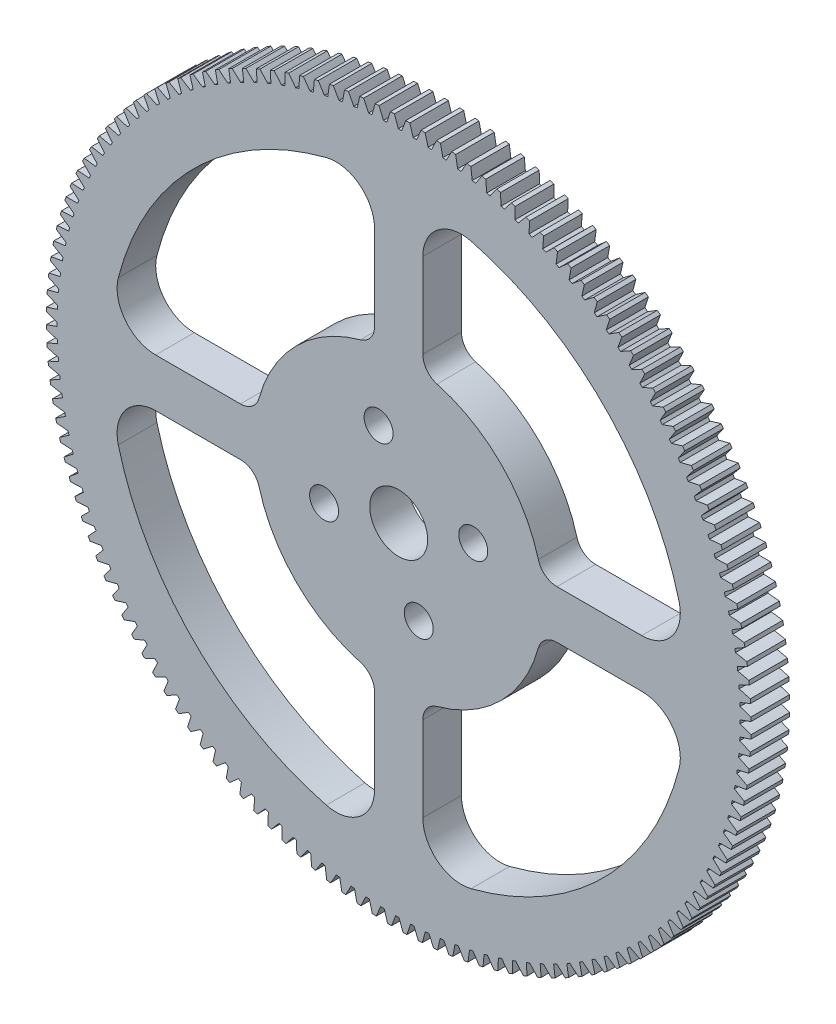
from build123d import *

# Parameters (mm, degrees)
SKETCH_2_R          = 3
EXTRUDE_1_DEPTH     = 4
CUT_EXTRUDE_2_DEPTH = 52.769702652
SKETCH_5_R          = 1.5
CUT_EXTRUDE_3_DEPTH = 52.769702652
FILLET_1_R          = 4
FILLET_2_R          = 2


with BuildPart() as part:
    # 草图2 → 凸台-拉伸1 (new body)
    with BuildSketch(Plane.XY):
        with BuildLine():
            ThreePointArc((1.862026944, 35.325960435), (1.684247483, 35.3348827), (1.506425378, 35.342910287))
            add(Edge.make_bspline(
                [(1.506425378, 35.342910287), (1.487691848, 35.41501693), (1.40978744, 35.703479678), (1.321355473, 35.989022929), (1.224023004, 36.271582602), (1.146373656, 36.481993194)],
                knots=[0.077505421, 0.077505421, 0.077505421, 0.077505421, 0.077505421, 0.092110525, 0.136079314, 0.136079314, 0.136079314, 0.136079314, 0.136079314], degree=4))
            ThreePointArc((1.146373656, 36.481993194), (0.942056255, 36.487840852), (0.73770931, 36.492544238))
            add(Edge.make_bspline(
                [(0.319357954, 35.373558423), (0.341787396, 35.444602305), (0.434473362, 35.728660689), (0.537522208, 36.009260219), (0.649305737, 36.28642086), (0.73770931, 36.492544238)],
                knots=[0.077505421, 0.077505421, 0.077505421, 0.077505421, 0.077505421, 0.092110525, 0.136079314, 0.136079314, 0.136079314, 0.136079314, 0.136079314], degree=4))
            ThreePointArc((0.319357954, 35.373558423), (0.141358517, 35.374717565), (-0.0366445, 35.37498102))
            add(Edge.make_bspline(
                [(-0.0366445, 35.37498102), (-0.058505447, 35.446201889), (-0.148918276, 35.730991941), (-0.249721297, 36.01240607), (-0.359286206, 36.290451226), (-0.446039631, 36.497274537)],
                knots=[0.077505421, 0.077505421, 0.077505421, 0.077505421, 0.077505421, 0.092110525, 0.136079314, 0.136079314, 0.136079314, 0.136079314, 0.136079314], degree=4))
            ThreePointArc((-0.446039631, 36.497274537), (-0.650417638, 36.494204429), (-0.854775249, 36.48998985))
            add(Edge.make_bspline(
                [(-1.223918951, 35.353820832), (-1.204609747, 35.425775455), (-1.124402452, 35.713606383), (-1.033691265, 35.998433772), (-0.934103706, 36.280206546), (-0.854775249, 36.48998985)],
                knots=[0.077505421, 0.077505421, 0.077505421, 0.077505421, 0.077505421, 0.092110525, 0.136079314, 0.136079314, 0.136079314, 0.136079314, 0.136079314], degree=4))
            ThreePointArc((-1.223918951, 35.353820832), (-1.401799534, 35.347214644), (-1.579644623, 35.339713466))
            add(Edge.make_bspline(
                [(-1.579644623, 35.339713466), (-1.604591374, 35.409912987), (-1.707340517, 35.69048823), (-1.820322708, 35.967237549), (-1.941911495, 36.240238914), (-2.037603855, 36.443081244)],
                knots=[0.077505421, 0.077505421, 0.077505421, 0.077505421, 0.077505421, 0.092110525, 0.136079314, 0.136079314, 0.136079314, 0.136079314, 0.136079314], degree=4))
            ThreePointArc((-2.037603855, 36.443081244), (-2.241653425, 36.431099214), (-2.445632695, 36.417974693))
            add(Edge.make_bspline(
                [(-2.764866057, 35.266785233), (-2.748713848, 35.339513627), (-2.681137901, 35.630569197), (-2.602937047, 35.91908226), (-2.515735029, 36.204930797), (-2.445632695, 36.417974693)],
                knots=[0.077505421, 0.077505421, 0.077505421, 0.077505421, 0.077505421, 0.092110525, 0.136079314, 0.136079314, 0.136079314, 0.136079314, 0.136079314], degree=4))
            ThreePointArc((-2.764866057, 35.266785233), (-2.942289179, 35.252426291), (-3.119637802, 35.237174759))
            add(Edge.make_bspline(
                [(-3.119637802, 35.237174759), (-3.14762287, 35.306219303), (-3.262512738, 35.582045646), (-3.387459031, 35.853603347), (-3.520840245, 36.121041247), (-3.625289386, 36.319516474)],
                knots=[0.077505421, 0.077505421, 0.077505421, 0.077505421, 0.077505421, 0.092110525, 0.136079314, 0.136079314, 0.136079314, 0.136079314, 0.136079314], degree=4))
            ThreePointArc((-3.625289386, 36.319516474), (-3.828622096, 36.298645331), (-4.031834739, 36.276635851))
            add(Edge.make_bspline(
                [(-4.300550083, 35.112617305), (-4.287585616, 35.185981027), (-4.232769651, 35.479707198), (-4.16722799, 35.771356733), (-4.092577508, 36.060736905), (-4.031834739, 36.276635851)],
                knots=[0.077505421, 0.077505421, 0.077505421, 0.077505421, 0.077505421, 0.092110525, 0.136079314, 0.136079314, 0.136079314, 0.136079314, 0.136079314], degree=4))
            ThreePointArc((-4.300550083, 35.112617305), (-4.477178009, 35.090532941), (-4.653692574, 35.067560087))
            add(Edge.make_bspline(
                [(-4.653692574, 35.067560087), (-4.684662686, 35.135318224), (-4.811474582, 35.405870616), (-4.948147134, 35.671719773), (-5.093066875, 35.933085125), (-5.206073971, 36.12681544)],
                knots=[0.077505421, 0.077505421, 0.077505421, 0.077505421, 0.077505421, 0.092110525, 0.136079314, 0.136079314, 0.136079314, 0.136079314, 0.136079314], degree=4))
            ThreePointArc((-5.206073971, 36.12681544), (-5.408302768, 36.097094913), (-5.610361958, 36.06624237))
            add(Edge.make_bspline(
                [(-5.828047768, 34.891610513), (-5.818295721, 34.965469911), (-5.776344084, 35.261307559), (-5.723586379, 35.555538396), (-5.661629533, 35.84789935), (-5.610361958, 36.06624237)],
                knots=[0.077505421, 0.077505421, 0.077505421, 0.077505421, 0.077505421, 0.092110525, 0.136079314, 0.136079314, 0.136079314, 0.136079314, 0.136079314], degree=4))
            ThreePointArc((-5.828047768, 34.891610513), (-6.003544277, 34.861842767), (-6.178888777, 34.831192321))
            add(Edge.make_bspline(
                [(-6.178888777, 34.831192321), (-6.212784981, 34.89753507), (-6.351277509, 35.162298499), (-6.499416157, 35.421933054), (-6.655598563, 35.676728333), (-6.7769485, 35.865344959)],
                knots=[0.077505421, 0.077505421, 0.077505421, 0.077505421, 0.077505421, 0.092110525, 0.136079314, 0.136079314, 0.136079314, 0.136079314, 0.136079314], degree=4))
            ThreePointArc((-6.7769485, 35.865344959), (-6.977688428, 35.826831624), (-7.178209533, 35.787194748))
            add(Edge.make_bspline(
                [(-7.344451433, 34.604185558), (-7.337930369, 34.678400037), (-7.308922918, 34.975786017), (-7.269049595, 35.27203807), (-7.219904324, 35.566823282), (-7.178209533, 35.787194748)],
                knots=[0.077505421, 0.077505421, 0.077505421, 0.077505421, 0.077505421, 0.092110525, 0.136079314, 0.136079314, 0.136079314, 0.136079314, 0.136079314], degree=4))
            ThreePointArc((-7.344451433, 34.604185558), (-7.518482457, 34.566791094), (-7.692323114, 34.528521401))
            add(Edge.make_bspline(
                [(-7.692323114, 34.528521401), (-7.729080887, 34.593322475), (-7.878990419, 34.851792948), (-8.038313172, 35.104718671), (-8.205460941, 35.352458861), (-8.334922721, 35.535602756)],
                knots=[0.077505421, 0.077505421, 0.077505421, 0.077505421, 0.077505421, 0.092110525, 0.136079314, 0.136079314, 0.136079314, 0.136079314, 0.136079314], degree=4))
            ThreePointArc((-8.334922721, 35.535602756), (-8.533791661, 35.488369924), (-8.732392978, 35.440024166))
            add(Edge.make_bspline(
                [(-8.846874517, 34.250889569), (-8.843596849, 34.325317857), (-8.827588802, 34.623686079), (-8.800675762, 34.921395416), (-8.764435617, 35.218043743), (-8.732392978, 35.440024166)],
                knots=[0.077505421, 0.077505421, 0.077505421, 0.077505421, 0.077505421, 0.092110525, 0.136079314, 0.136079314, 0.136079314, 0.136079314, 0.136079314], degree=4))
            ThreePointArc((-8.846874517, 34.250889569), (-9.019108779, 34.20593957), (-9.191114677, 34.160123477))
            add(Edge.make_bspline(
                [(-9.191114677, 34.160123477), (-9.230664048, 34.223259524), (-9.391705223, 34.474945029), (-9.561908801, 34.720680462), (-9.739703758, 34.960893974), (-9.877030943, 35.138216513)],
                knots=[0.077505421, 0.077505421, 0.077505421, 0.077505421, 0.077505421, 0.092110525, 0.136079314, 0.136079314, 0.136079314, 0.136079314, 0.136079314], degree=4))
            ThreePointArc((-9.877030943, 35.138216513), (-10.073650337, 35.082354096), (-10.269953818, 35.025391484))
            add(Edge.make_bspline(
                [(-10.332457072, 33.832395065), (-10.332429041, 33.906895484), (-10.329450868, 34.205677986), (-10.315549343, 34.5042779), (-10.292283308, 34.802224657), (-10.269953818, 35.025391484)],
                knots=[0.077505421, 0.077505421, 0.077505421, 0.077505421, 0.077505421, 0.092110525, 0.136079314, 0.136079314, 0.136079314, 0.136079314, 0.136079314], degree=4))
            ThreePointArc((-10.332457072, 33.832395065), (-10.502566714, 33.779975095), (-10.672410431, 33.726699818))
            add(Edge.make_bspline(
                [(-10.672410431, 33.726699818), (-10.714676115, 33.788050654), (-10.886542383, 34.032472092), (-11.067302793, 34.270549463), (-11.255406495, 34.502779039), (-11.400337676, 34.673942679)],
                knots=[0.077505421, 0.077505421, 0.077505421, 0.077505421, 0.077505421, 0.092110525, 0.136079314, 0.136079314, 0.136079314, 0.136079314, 0.136079314], degree=4))
            ThreePointArc((-11.400337676, 34.673942679), (-11.594333247, 34.609557012), (-11.787965216, 34.544085978))
            add(Edge.make_bspline(
                [(-11.798371209, 33.349498674), (-11.801592866, 33.423929407), (-11.811650238, 33.722557442), (-11.810786689, 34.02147953), (-11.800539054, 34.320157558), (-11.787965216, 34.544085978)],
                knots=[0.077505421, 0.077505421, 0.077505421, 0.077505421, 0.077505421, 0.092110525, 0.136079314, 0.136079314, 0.136079314, 0.136079314, 0.136079314], degree=4))
            ThreePointArc((-11.798371209, 33.349498674), (-11.966032416, 33.289708518), (-12.133390645, 33.229075468))
            add(Edge.make_bspline(
                [(-12.133390645, 33.229075468), (-12.178292188, 33.288524308), (-12.36065639, 33.52521641), (-12.551629546, 33.755182526), (-12.749683926, 33.978986103), (-12.901943218, 34.143665023)],
                knots=[0.077505421, 0.077505421, 0.077505421, 0.077505421, 0.077505421, 0.092110525, 0.136079314, 0.136079314, 0.136079314, 0.136079314, 0.136079314], degree=4))
            ThreePointArc((-12.901943218, 34.143665023), (-13.092945685, 34.070878669), (-13.283537553, 33.997023842))
            add(Edge.make_bspline(
                [(-13.241826475, 32.803119617), (-13.248291689, 32.877338982), (-13.27136546, 33.175244092), (-13.283541532, 33.473919341), (-13.286331802, 33.772760089), (-13.283537553, 33.997023842)],
                knots=[0.077505421, 0.077505421, 0.077505421, 0.077505421, 0.077505421, 0.092110525, 0.136079314, 0.136079314, 0.136079314, 0.136079314, 0.136079314], degree=4))
            ThreePointArc((-13.241826475, 32.803119617), (-13.406720096, 32.736073089), (-13.57127426, 32.668197685))
            add(Edge.make_bspline(
                [(-13.57127426, 32.668197685), (-13.618726188, 32.725631365), (-13.811241185, 32.954143574), (-14.012063558, 33.175560681), (-14.219691609, 33.390512235), (-14.378989177, 33.548392961)],
                knots=[0.077505421, 0.077505421, 0.077505421, 0.077505421, 0.077505421, 0.092110525, 0.136079314, 0.136079314, 0.136079314, 0.136079314, 0.136079314], degree=4))
            ThreePointArc((-14.378989177, 33.548392961), (-14.566634956, 33.467344473), (-14.75382392, 33.385246438))
            add(Edge.make_bspline(
                [(-14.660075171, 32.194297957), (-14.669771636, 32.268164673), (-14.705817884, 32.56477978), (-14.731010398, 32.862639643), (-14.746833263, 33.161074251), (-14.75382392, 33.385246438)],
                knots=[0.077505421, 0.077505421, 0.077505421, 0.077505421, 0.077505421, 0.092110525, 0.136079314, 0.136079314, 0.136079314, 0.136079314, 0.136079314], degree=4))
            ThreePointArc((-14.660075171, 32.194297957), (-14.821887322, 32.120122684), (-14.983324183, 32.04513413))
            add(Edge.make_bspline(
                [(-14.983324183, 32.04513413), (-15.03323617, 32.100443322), (-15.235535497, 32.320340652), (-15.44582481, 32.53278727), (-15.662631301, 32.73847763), (-15.828663914, 32.889259625)],
                knots=[0.077505421, 0.077505421, 0.077505421, 0.077505421, 0.077505421, 0.092110525, 0.136079314, 0.136079314, 0.136079314, 0.136079314, 0.136079314], degree=4))
            ThreePointArc((-15.828663914, 32.889259625), (-16.01259581, 32.800103284), (-16.196025546, 32.70991832))
            add(Edge.make_bspline(
                [(-16.050417582, 31.524192622), (-16.063326838, 31.597566079), (-16.112276948, 31.892326558), (-16.150437948, 32.188804043), (-16.179263289, 32.486264424), (-16.196025546, 32.70991832)],
                knots=[0.077505421, 0.077505421, 0.077505421, 0.077505421, 0.077505421, 0.092110525, 0.136079314, 0.136079314, 0.136079314, 0.136079314, 0.136079314], degree=4))
            ThreePointArc((-16.050417582, 31.524192622), (-16.208840243, 31.443029799), (-16.366852498, 31.361070841))
            add(Edge.make_bspline(
                [(-16.366852498, 31.361070841), (-16.419129532, 31.414150261), (-16.630828102, 31.625014125), (-16.850184058, 31.82808585), (-17.075756284, 32.024123471), (-17.248207889, 32.167519715)],
                knots=[0.077505421, 0.077505421, 0.077505421, 0.077505421, 0.077505421, 0.092110525, 0.136079314, 0.136079314, 0.136079314, 0.136079314, 0.136079314], degree=4))
            ThreePointArc((-17.248207889, 32.167519715), (-17.428075778, 32.070425234), (-17.607397116, 31.972325014))
            add(Edge.make_bspline(
                [(-17.41020711, 30.794079194), (-17.426304585, 30.866819722), (-17.488065376, 31.159164481), (-17.539122223, 31.453695225), (-17.580895167, 31.749615146), (-17.607397116, 31.972325014)],
                knots=[0.077505421, 0.077505421, 0.077505421, 0.077505421, 0.077505421, 0.092110525, 0.136079314, 0.136079314, 0.136079314, 0.136079314, 0.136079314], degree=4))
            ThreePointArc((-17.41020711, 30.794079194), (-17.564938716, 30.706083321), (-17.719225578, 30.617309972))
            add(Edge.make_bspline(
                [(-17.719225578, 30.617309972), (-17.773768148, 30.66805858), (-17.99446298, 30.869487585), (-18.222468022, 31.062797859), (-18.456376595, 31.248809574), (-18.63491892, 31.384547103)],
                knots=[0.077505421, 0.077505421, 0.077505421, 0.077505421, 0.077505421, 0.092110525, 0.136079314, 0.136079314, 0.136079314, 0.136079314, 0.136079314], degree=4))
            ThreePointArc((-18.63491892, 31.384547103), (-18.810380412, 31.279699307), (-18.985252005, 31.17387057))
            add(Edge.make_bspline(
                [(-18.73685532, 30.005347486), (-18.75611037, 30.077316619), (-18.830564278, 30.366689163), (-18.894419781, 30.65871251), (-18.949060812, 30.952528671), (-18.985252005, 31.17387057)],
                knots=[0.077505421, 0.077505421, 0.077505421, 0.077505421, 0.077505421, 0.092110525, 0.136079314, 0.136079314, 0.136079314, 0.136079314, 0.136079314], degree=4))
            ThreePointArc((-18.73685532, 30.005347486), (-18.887601329, 29.910686068), (-19.037869105, 29.815267313))
            add(Edge.make_bspline(
                [(-19.037869105, 29.815267313), (-19.094573386, 29.863588505), (-19.323844376, 30.055199222), (-19.560064483, 30.238380067), (-19.801864143, 30.414011791), (-19.986157323, 30.541832221)],
                knots=[0.077505421, 0.077505421, 0.077505421, 0.077505421, 0.077505421, 0.092110525, 0.136079314, 0.136079314, 0.136079314, 0.136079314, 0.136079314], degree=4))
            ThreePointArc((-19.986157323, 30.541832221), (-20.156878419, 30.429430695), (-20.326967388, 30.316074891))
            add(Edge.make_bspline(
                [(-20.02783686, 29.159498893), (-20.050212834, 29.230559634), (-20.137218131, 29.516409126), (-20.213750737, 29.805369194), (-20.281155843, 30.096522298), (-20.326967388, 30.316074891)],
                knots=[0.077505421, 0.077505421, 0.077505421, 0.077505421, 0.077505421, 0.092110525, 0.136079314, 0.136079314, 0.136079314, 0.136079314, 0.136079314], degree=4))
            ThreePointArc((-20.02783686, 29.159498893), (-20.17431032, 29.058352123), (-20.320272967, 28.956469598))
            add(Edge.make_bspline(
                [(-20.320272967, 28.956469598), (-20.379031018, 29.002271393), (-20.616441735, 29.183699079), (-20.860427249, 29.3564018), (-21.109657718, 29.521319208), (-21.299350941, 29.640979226)],
                knots=[0.077505421, 0.077505421, 0.077505421, 0.077505421, 0.077505421, 0.092110525, 0.136079314, 0.136079314, 0.136079314, 0.136079314, 0.136079314], degree=4))
            ThreePointArc((-21.299350941, 29.640979226), (-21.465006662, 29.521237931), (-21.629989233, 29.400570841))
            add(Edge.make_bspline(
                [(-21.280694275, 28.258143537), (-21.306148577, 28.328160618), (-21.405539645, 28.609942926), (-21.49460367, 28.895289663), (-21.574644541, 29.183225485), (-21.629989233, 29.400570841)],
                knots=[0.077505421, 0.077505421, 0.077505421, 0.077505421, 0.077505421, 0.092110525, 0.136079314, 0.136079314, 0.136079314, 0.136079314, 0.136079314], degree=4))
            ThreePointArc((-21.280694275, 28.258143537), (-21.422616364, 28.150703954), (-21.563996033, 28.042551597))
            add(Edge.make_bspline(
                [(-21.563996033, 28.042551597), (-21.624696007, 28.085746809), (-21.869794525, 28.256646106), (-22.121081006, 28.418541954), (-22.37726786, 28.572431117), (-22.572000033, 28.683702943)],
                knots=[0.077505421, 0.077505421, 0.077505421, 0.077505421, 0.077505421, 0.092110525, 0.136079314, 0.136079314, 0.136079314, 0.136079314, 0.136079314], degree=4))
            ThreePointArc((-22.572000033, 28.683702943), (-22.732275045, 28.556849814), (-22.891837165, 28.429101133))
            add(Edge.make_bspline(
                [(-22.493042678, 27.302997199), (-22.521526856, 27.371837338), (-22.633114497, 27.649016075), (-22.734540403, 27.930206307), (-22.827064677, 28.214376743), (-22.891837165, 28.429101133)],
                knots=[0.077505421, 0.077505421, 0.077505421, 0.077505421, 0.077505421, 0.092110525, 0.136079314, 0.136079314, 0.136079314, 0.136079314, 0.136079314], degree=4))
            ThreePointArc((-22.493042678, 27.302997199), (-22.63014324, 27.18946932), (-22.766670808, 27.075253005))
            add(Edge.make_bspline(
                [(-22.766670808, 27.075253005), (-22.829197157, 27.11575941), (-23.081516919, 27.275805001), (-23.339626028, 27.426585797), (-23.6022816, 27.569153779), (-23.80168204, 27.6718256)],
                knots=[0.077505421, 0.077505421, 0.077505421, 0.077505421, 0.077505421, 0.092110525, 0.136079314, 0.136079314, 0.136079314, 0.136079314, 0.136079314], degree=4))
            ThreePointArc((-23.80168204, 27.6718256), (-23.95627125, 27.53810211), (-24.110109183, 27.403515015))
            add(Edge.make_bspline(
                [(-23.662574297, 26.295878054), (-23.694034129, 26.36341021), (-23.81760593, 26.635457749), (-23.931200646, 26.911956215), (-24.036032198, 27.191820332), (-24.110109183, 27.403515015)],
                knots=[0.077505421, 0.077505421, 0.077505421, 0.077505421, 0.077505421, 0.092110525, 0.136079314, 0.136079314, 0.136079314, 0.136079314, 0.136079314], degree=4))
            ThreePointArc((-23.662574297, 26.295878054), (-23.794592353, 26.176477986), (-23.926007931, 26.056415131))
            add(Edge.make_bspline(
                [(-23.926007931, 26.056415131), (-23.990241634, 26.094155621), (-24.249302333, 26.243042851), (-24.513742746, 26.382421576), (-24.782367056, 26.513396989), (-24.986056193, 26.607273365)],
                knots=[0.077505421, 0.077505421, 0.077505421, 0.077505421, 0.077505421, 0.092110525, 0.136079314, 0.136079314, 0.136079314, 0.136079314, 0.136079314], degree=4))
            ThreePointArc((-24.986056193, 26.607273365), (-25.134665331, 26.466934063), (-25.282486238, 26.325764749))
            add(Edge.make_bspline(
                [(-24.78706286, 25.238703211), (-24.821438461, 25.304798832), (-24.956759196, 25.571197316), (-25.082306488, 25.842477684), (-25.199245766, 26.117502745), (-25.282486238, 26.325764749)],
                knots=[0.077505421, 0.077505421, 0.077505421, 0.077505421, 0.077505421, 0.092110525, 0.136079314, 0.136079314, 0.136079314, 0.136079314, 0.136079314], degree=4))
            ThreePointArc((-24.78706286, 25.238703211), (-24.913747107, 25.113658238), (-25.039800538, 24.987977389))
            add(Edge.make_bspline(
                [(-25.039800538, 24.987977389), (-25.105619321, 25.022880124), (-25.370927823, 25.160325577), (-25.641196161, 25.288036916), (-25.915277867, 25.407170442), (-26.122867968, 25.492072673)],
                knots=[0.077505421, 0.077505421, 0.077505421, 0.077505421, 0.077505421, 0.092110525, 0.136079314, 0.136079314, 0.136079314, 0.136079314, 0.136079314], degree=4))
            ThreePointArc((-26.122867968, 25.492072673), (-26.265214148, 25.345384703), (-26.406736644, 25.197901894))
            add(Edge.make_bspline(
                [(-25.864367841, 24.133485061), (-25.901593774, 24.198018332), (-26.048405852, 24.458260656), (-26.185666735, 24.723806529), (-26.314491136, 24.993469007), (-26.406736644, 25.197901894)],
                knots=[0.077505421, 0.077505421, 0.077505421, 0.077505421, 0.077505421, 0.092110525, 0.136079314, 0.136079314, 0.136079314, 0.136079314, 0.136079314], degree=4))
            ThreePointArc((-25.864367841, 24.133485061), (-25.985477127, 24.003033215), (-26.105928462, 23.871973613))
            add(Edge.make_bspline(
                [(-26.105928462, 23.871973613), (-26.173207036, 23.903972153), (-26.444258309, 24.029714194), (-26.719840102, 24.14551504), (-26.998857474, 24.252579901), (-27.209953378, 24.328346371)],
                knots=[0.077505421, 0.077505421, 0.077505421, 0.077505421, 0.077505421, 0.092110525, 0.136079314, 0.136079314, 0.136079314, 0.136079314, 0.136079314], degree=4))
            ThreePointArc((-27.209953378, 24.328346371), (-27.345765638, 24.175588963), (-27.480720325, 24.0220734))
            add(Edge.make_bspline(
                [(-26.892438527, 22.982327451), (-26.932443931, 23.045175528), (-27.090467887, 23.298766306), (-27.239181077, 23.558072203), (-27.379645378, 23.821858781), (-27.480720325, 24.0220734)],
                knots=[0.077505421, 0.077505421, 0.077505421, 0.077505421, 0.077505421, 0.092110525, 0.136079314, 0.136079314, 0.136079314, 0.136079314, 0.136079314], degree=4))
            ThreePointArc((-26.892438527, 22.982327451), (-27.007742314, 22.846717053), (-27.122362266, 22.710528177))
            add(Edge.make_bspline(
                [(-27.122362266, 22.710528177), (-27.190972563, 22.739561612), (-27.467250646, 22.853360884), (-27.747621309, 22.957030805), (-28.031043222, 23.051823197), (-28.245243096, 23.118309679)],
                knots=[0.077505421, 0.077505421, 0.077505421, 0.077505421, 0.077505421, 0.092110525, 0.136079314, 0.136079314, 0.136079314, 0.136079314, 0.136079314], degree=4))
            ThreePointArc((-28.245243096, 23.118309679), (-28.374262908, 22.959773615), (-28.502392893, 22.800517524))
            add(Edge.make_bspline(
                [(-27.869317928, 21.787421675), (-27.91202665, 21.848464923), (-28.080961677, 22.09492143), (-28.240844089, 22.347493747), (-28.392680908, 22.604902292), (-28.502392893, 22.800517524)],
                knots=[0.077505421, 0.077505421, 0.077505421, 0.077505421, 0.077505421, 0.092110525, 0.136079314, 0.136079314, 0.136079314, 0.136079314, 0.136079314], degree=4))
            ThreePointArc((-27.869317928, 21.787421675), (-27.978596729, 21.646910867), (-28.087167113, 21.505851961))
            add(Edge.make_bspline(
                [(-28.087167113, 21.505851961), (-28.156978529, 21.531865023), (-28.437957511, 21.633504902), (-28.722583341, 21.724846556), (-29.009870285, 21.807186036), (-29.226766389, 21.864265971)],
                knots=[0.077505421, 0.077505421, 0.077505421, 0.077505421, 0.077505421, 0.092110525, 0.136079314, 0.136079314, 0.136079314, 0.136079314, 0.136079314], degree=4))
            ThreePointArc((-29.226766389, 21.864265971), (-29.348748156, 21.700253033), (-29.469809537, 21.535559567))
            add(Edge.make_bspline(
                [(-28.793146498, 20.551042302), (-28.838477241, 20.610164523), (-29.018001761, 20.849017616), (-29.188749049, 21.094375567), (-29.351669357, 21.344916087), (-29.469809537, 21.535559567)],
                knots=[0.077505421, 0.077505421, 0.077505421, 0.077505421, 0.077505421, 0.092110525, 0.136079314, 0.136079314, 0.136079314, 0.136079314, 0.136079314], degree=4))
            ThreePointArc((-28.793146498, 20.551042302), (-28.896192295, 20.405898556), (-28.998506441, 20.260238133))
            add(Edge.make_bspline(
                [(-28.998506441, 20.260238133), (-29.069386085, 20.283181305), (-29.354531107, 20.372468315), (-29.642870303, 20.451307827), (-29.933475412, 20.521037658), (-30.15265487, 20.56860239)],
                knots=[0.077505421, 0.077505421, 0.077505421, 0.077505421, 0.077505421, 0.092110525, 0.136079314, 0.136079314, 0.136079314, 0.136079314, 0.136079314], degree=4))
            ThreePointArc((-30.15265487, 20.56860239), (-30.267366394, 20.399424786), (-30.381128723, 20.229607448))
            add(Edge.make_bspline(
                [(-29.662165678, 19.275542853), (-29.71003215, 19.332631503), (-29.899804429, 19.563426512), (-30.081091567, 19.801103044), (-30.254785234, 20.044298621), (-30.381128723, 20.229607448)],
                knots=[0.077505421, 0.077505421, 0.077505421, 0.077505421, 0.077505421, 0.092110525, 0.136079314, 0.136079314, 0.136079314, 0.136079314, 0.136079314], degree=4))
            ThreePointArc((-29.662165678, 19.275542853), (-29.758782316, 19.126042457), (-29.854645464, 18.97605779))
            add(Edge.make_bspline(
                [(-29.854645464, 18.97605779), (-29.926458413, 18.995887398), (-30.215226685, 19.072651576), (-30.506730377, 19.138838871), (-30.800100467, 19.195826318), (-31.021146059, 19.233785306)],
                knots=[0.077505421, 0.077505421, 0.077505421, 0.077505421, 0.077505421, 0.092110525, 0.136079314, 0.136079314, 0.136079314, 0.136079314, 0.136079314], degree=4))
            ThreePointArc((-31.021146059, 19.233785306), (-31.128368979, 19.059765074), (-31.234615704, 18.885147122))
            add(Edge.make_bspline(
                [(-30.474721239, 17.963351313), (-30.525032325, 18.018297721), (-30.724691119, 18.240595313), (-30.916173017, 18.470137996), (-31.100309409, 18.705525693), (-31.234615704, 18.885147122)],
                knots=[0.077505421, 0.077505421, 0.077505421, 0.077505421, 0.077505421, 0.092110525, 0.136079314, 0.136079314, 0.136079314, 0.136079314, 0.136079314], degree=4))
            ThreePointArc((-30.474721239, 17.963351313), (-30.564724804, 17.809778849), (-30.653954472, 17.655755442))
            add(Edge.make_bspline(
                [(-30.653954472, 17.655755442), (-30.726564027, 17.672433741), (-31.018405861, 17.736528961), (-31.312519156, 17.789938048), (-31.60809578, 17.834074631), (-31.830586733, 17.862355617)],
                knots=[0.077505421, 0.077505421, 0.077505421, 0.077505421, 0.077505421, 0.092110525, 0.136079314, 0.136079314, 0.136079314, 0.136079314, 0.136079314], degree=4))
            ThreePointArc((-31.830586733, 17.862355617), (-31.930116946, 17.683824016), (-32.028645819, 17.504737845))
            add(Edge.make_bspline(
                [(-31.229266437, 16.616965512), (-31.281926366, 16.669665085), (-31.491091614, 16.883042104), (-31.692403775, 17.104013991), (-31.886632377, 17.331145734), (-32.028645819, 17.504737845)],
                knots=[0.077505421, 0.077505421, 0.077505421, 0.077505421, 0.077505421, 0.092110525, 0.136079314, 0.136079314, 0.136079314, 0.136079314, 0.136079314], degree=4))
            ThreePointArc((-31.229266437, 16.616965512), (-31.312485601, 16.459613315), (-31.394911935, 16.301844361))
            add(Edge.make_bspline(
                [(-31.394911935, 16.301844361), (-31.468179879, 16.315339601), (-31.762539739, 16.366643854), (-32.058702775, 16.407173066), (-32.355923286, 16.43837477), (-32.579436077, 16.45692392)],
                knots=[0.077505421, 0.077505421, 0.077505421, 0.077505421, 0.077505421, 0.092110525, 0.136079314, 0.136079314, 0.136079314, 0.136079314, 0.136079314], degree=4))
            ThreePointArc((-32.579436077, 16.45692392), (-32.671084119, 16.274220795), (-32.761707586, 16.091007304))
            add(Edge.make_bspline(
                [(-31.92436495, 15.238948373), (-31.979273483, 15.289300793), (-32.197547026, 15.493351066), (-32.408306241, 15.705331523), (-32.612257327, 15.923774954), (-32.761707586, 16.091007304)],
                knots=[0.077505421, 0.077505421, 0.077505421, 0.077505421, 0.077505421, 0.092110525, 0.136079314, 0.136079314, 0.136079314, 0.136079314, 0.136079314], degree=4))
            ThreePointArc((-31.92436495, 15.238948373), (-32.000641302, 15.078115971), (-32.0761074, 14.916901792))
            add(Edge.make_bspline(
                [(-32.0761074, 14.916901792), (-32.149894263, 14.927188285), (-32.446211817, 14.965603911), (-32.743860831, 14.993176098), (-33.042159453, 15.011383529), (-33.266268612, 15.020165533)],
                knots=[0.077505421, 0.077505421, 0.077505421, 0.077505421, 0.077505421, 0.092110525, 0.136079314, 0.136079314, 0.136079314, 0.136079314, 0.136079314], degree=4))
            ThreePointArc((-33.266268612, 15.020165533), (-33.349860027, 14.833638669), (-33.43240558, 14.646646617))
            add(Edge.make_bspline(
                [(-32.558693621, 13.83192303), (-32.615746234, 13.879832449), (-32.842712577, 14.074167552), (-33.062517654, 14.276753063), (-33.275802993, 14.486092364), (-33.43240558, 14.646646617)],
                knots=[0.077505421, 0.077505421, 0.077505421, 0.077505421, 0.077505421, 0.092110525, 0.136079314, 0.136079314, 0.136079314, 0.136079314, 0.136079314], degree=4))
            ThreePointArc((-32.558693621, 13.83192303), (-32.627881964, 13.667916577), (-32.696244171, 13.503564053))
            add(Edge.make_bspline(
                [(-32.696244171, 13.503564053), (-32.770409496, 13.510622218), (-33.068120687, 13.536076091), (-33.366689087, 13.550638767), (-33.665497992, 13.555817265), (-33.889776914, 13.554815407)],
                knots=[0.077505421, 0.077505421, 0.077505421, 0.077505421, 0.077505421, 0.092110525, 0.136079314, 0.136079314, 0.136079314, 0.136079314, 0.136079314], degree=4))
            ThreePointArc((-33.889776914, 13.554815407), (-33.965152581, 13.364819869), (-34.03946309, 13.174405205))
            add(Edge.make_bspline(
                [(-33.131044968, 12.398567835), (-33.190133059, 12.443943055), (-33.425360159, 12.628193061), (-33.653792685, 12.820997993), (-33.876006276, 13.020834673), (-34.03946309, 13.174405205)],
                knots=[0.077505421, 0.077505421, 0.077505421, 0.077505421, 0.077505421, 0.092110525, 0.136079314, 0.136079314, 0.136079314, 0.136079314, 0.136079314], degree=4))
            ThreePointArc((-33.131044968, 12.398567835), (-33.193013598, 12.231699527), (-33.254141782, 12.064521513))
            add(Edge.make_bspline(
                [(-33.254141782, 12.064521513), (-33.328544391, 12.068337913), (-33.62708251, 12.08078158), (-33.926001954, 12.082307025), (-34.224752342, 12.074446733), (-34.4487741, 12.063662919)],
                knots=[0.077505421, 0.077505421, 0.077505421, 0.077505421, 0.077505421, 0.092110525, 0.136079314, 0.136079314, 0.136079314, 0.136079314, 0.136079314], degree=4))
            ThreePointArc((-34.4487741, 12.063662919), (-34.515790537, 11.870560374), (-34.581724548, 11.677085565))
            add(Edge.make_bspline(
                [(-33.640329487, 10.941611261), (-33.701340579, 10.984365908), (-33.944380667, 11.158180087), (-34.18100581, 11.340837425), (-34.411724656, 11.530791084), (-34.581724548, 11.677085565)],
                knots=[0.077505421, 0.077505421, 0.077505421, 0.077505421, 0.077505421, 0.092110525, 0.136079314, 0.136079314, 0.136079314, 0.136079314, 0.136079314], degree=4))
            ThreePointArc((-33.640329487, 10.941611261), (-33.694960443, 10.772198741), (-33.748738245, 10.602513469))
            add(Edge.make_bspline(
                [(-33.748738245, 10.602513469), (-33.823236508, 10.603080841), (-34.12203327, 10.602490615), (-34.420734748, 10.590975925), (-34.718857931, 10.570091805), (-34.942196086, 10.549546563)],
                knots=[0.077505421, 0.077505421, 0.077505421, 0.077505421, 0.077505421, 0.092110525, 0.136079314, 0.136079314, 0.136079314, 0.136079314, 0.136079314], degree=4))
            ThreePointArc((-34.942196086, 10.549546563), (-35.000725724, 10.353704593), (-35.058157728, 10.157537928))
            add(Edge.make_bspline(
                [(-34.085577728, 9.463826709), (-34.148395682, 9.503879396), (-34.398786118, 9.666926883), (-34.643153447, 9.839088927), (-34.881938362, 10.018797978), (-35.058157728, 10.157537928)],
                knots=[0.077505421, 0.077505421, 0.077505421, 0.077505421, 0.077505421, 0.092110525, 0.136079314, 0.136079314, 0.136079314, 0.136079314, 0.136079314], degree=4))
            ThreePointArc((-34.085577728, 9.463826709), (-34.132767017, 9.292192463), (-34.179092066, 9.120322939))
            add(Edge.make_bspline(
                [(-34.179092066, 9.120322939), (-34.253544172, 9.117640203), (-34.552030801, 9.104017206), (-34.849945717, 9.079484301), (-35.1468742, 9.045616107), (-35.369103616, 9.015348546)],
                knots=[0.077505421, 0.077505421, 0.077505421, 0.077505421, 0.077505421, 0.092110525, 0.136079314, 0.136079314, 0.136079314, 0.136079314, 0.136079314], degree=4))
            ThreePointArc((-35.369103616, 9.015348546), (-35.41903504, 8.817139947), (-35.467855711, 8.61865484))
            add(Edge.make_bspline(
                [(-34.465942134, 7.968027224), (-34.530447373, 8.00530171), (-34.787711524, 8.157272134), (-35.039355872, 8.318611165), (-35.285752315, 8.487733521), (-35.467855711, 8.61865484)],
                knots=[0.077505421, 0.077505421, 0.077505421, 0.077505421, 0.077505421, 0.092110525, 0.136079314, 0.136079314, 0.136079314, 0.136079314, 0.136079314], degree=4))
            ThreePointArc((-34.465942134, 7.968027224), (-34.505599928, 7.794497968), (-34.544384043, 7.620771356))
            add(Edge.make_bspline(
                [(-34.544384043, 7.620771356), (-34.618648268, 7.614843618), (-34.916256577, 7.588213783), (-35.212817834, 7.550709361), (-35.507986397, 7.503921565), (-35.728684047, 7.4639893)],
                knots=[0.077505421, 0.077505421, 0.077505421, 0.077505421, 0.077505421, 0.092110525, 0.136079314, 0.136079314, 0.136079314, 0.136079314, 0.136079314], degree=4))
            ThreePointArc((-35.728684047, 7.4639893), (-35.769922209, 7.263791374), (-35.810038616, 7.063365653))
            add(Edge.make_bspline(
                [(-34.78069866, 6.457060147), (-34.846768394, 6.491485476), (-35.110416544, 6.632089554), (-35.368858892, 6.782298454), (-35.622397834, 6.94051218), (-35.810038616, 7.063365653)],
                knots=[0.077505421, 0.077505421, 0.077505421, 0.077505421, 0.077505421, 0.092110525, 0.136079314, 0.136079314, 0.136079314, 0.136079314, 0.136079314], degree=4))
            ThreePointArc((-34.78069866, 6.457060147), (-34.812749469, 6.281966204), (-34.843918822, 6.106713202))
            add(Edge.make_bspline(
                [(-34.843918822, 6.106713202), (-34.917853799, 6.097551745), (-35.214017274, 6.057965764), (-35.50866035, 6.007561218), (-35.801507123, 5.947942881), (-36.020252897, 5.898421927)],
                knots=[0.077505421, 0.077505421, 0.077505421, 0.077505421, 0.077505421, 0.092110525, 0.136079314, 0.136079314, 0.136079314, 0.136079314, 0.136079314], degree=4))
            ThreePointArc((-36.020252897, 5.898421927), (-36.052719299, 5.696615761), (-36.084055076, 5.494630948))
            add(Edge.make_bspline(
                [(-35.029248149, 4.933801689), (-35.096756612, 4.965312332), (-35.366286891, 5.094282415), (-35.631035279, 5.233075252), (-35.891234094, 5.380079181), (-36.084055076, 5.494630948)],
                knots=[0.077505421, 0.077505421, 0.077505421, 0.077505421, 0.077505421, 0.092110525, 0.136079314, 0.136079314, 0.136079314, 0.136079314, 0.136079314], degree=4))
            ThreePointArc((-35.029248149, 4.933801689), (-35.053630963, 4.75747636), (-35.077126221, 4.581030571))
            add(Edge.make_bspline(
                [(-35.077126221, 4.581030571), (-35.150591211, 4.568652836), (-35.444746087, 4.516186063), (-35.736910113, 4.45297734), (-36.026877646, 4.38064195), (-36.243255149, 4.321626572)],
                knots=[0.077505421, 0.077505421, 0.077505421, 0.077505421, 0.077505421, 0.092110525, 0.136079314, 0.136079314, 0.136079314, 0.136079314, 0.136079314], degree=4))
            ThreePointArc((-36.243255149, 4.321626572), (-36.266887989, 4.118596317), (-36.289383487, 3.915436901))
            add(Edge.make_bspline(
                [(-35.211117474, 3.401151459), (-35.279936158, 3.429687433), (-35.5548355, 3.546778019), (-35.825385965, 3.673890594), (-36.09174935, 3.809404894), (-36.289383487, 3.915436901)],
                knots=[0.077505421, 0.077505421, 0.077505421, 0.077505421, 0.077505421, 0.092110525, 0.136079314, 0.136079314, 0.136079314, 0.136079314, 0.136079314], degree=4))
            ThreePointArc((-35.211117474, 3.401151459), (-35.227785878, 3.223930389), (-35.243562316, 3.046627689))
            add(Edge.make_bspline(
                [(-35.243562316, 3.046627689), (-35.316417475, 3.031057237), (-35.608003812, 2.965809545), (-35.897132637, 2.889916967), (-36.183668959, 2.805002218), (-36.397266304, 2.736604755)],
                knots=[0.077505421, 0.077505421, 0.077505421, 0.077505421, 0.077505421, 0.092110525, 0.136079314, 0.136079314, 0.136079314, 0.136079314, 0.136079314], degree=4))
            ThreePointArc((-36.397266304, 2.736604755), (-36.412020595, 2.53273689), (-36.425632994, 2.328789597))
            add(Edge.make_bspline(
                [(-35.325960435, 1.862026944), (-35.395958341, 1.887533929), (-35.675703459, 1.99252213), (-35.951540993, 2.107712476), (-36.22356191, 2.231479189), (-36.425632994, 2.328789597)],
                knots=[0.077505421, 0.077505421, 0.077505421, 0.077505421, 0.077505421, 0.092110525, 0.136079314, 0.136079314, 0.136079314, 0.136079314, 0.136079314], degree=4))
            ThreePointArc((-35.325960435, 1.862026944), (-35.3348827, 1.684247483), (-35.342910287, 1.506425378))
            add(Edge.make_bspline(
                [(-35.342910287, 1.506425378), (-35.41501693, 1.487691848), (-35.703479678, 1.40978744), (-35.989022929, 1.321355473), (-36.271582602, 1.224023004), (-36.481993194, 1.146373656)],
                knots=[0.077505421, 0.077505421, 0.077505421, 0.077505421, 0.077505421, 0.092110525, 0.136079314, 0.136079314, 0.136079314, 0.136079314, 0.136079314], degree=4))
            ThreePointArc((-36.481993194, 1.146373656), (-36.487840852, 0.942056255), (-36.492544238, 0.73770931))
            add(Edge.make_bspline(
                [(-35.373558423, 0.319357954), (-35.444602305, 0.341787396), (-35.728660689, 0.434473362), (-36.009260219, 0.537522208), (-36.28642086, 0.649305737), (-36.492544238, 0.73770931)],
                knots=[0.077505421, 0.077505421, 0.077505421, 0.077505421, 0.077505421, 0.092110525, 0.136079314, 0.136079314, 0.136079314, 0.136079314, 0.136079314], degree=4))
            ThreePointArc((-35.373558423, 0.319357954), (-35.374717565, 0.141358517), (-35.37498102, -0.0366445))
            add(Edge.make_bspline(
                [(-35.37498102, -0.0366445), (-35.446201889, -0.058505447), (-35.730991941, -0.148918276), (-36.01240607, -0.249721297), (-36.290451226, -0.359286206), (-36.497274537, -0.446039631)],
                knots=[0.077505421, 0.077505421, 0.077505421, 0.077505421, 0.077505421, 0.092110525, 0.136079314, 0.136079314, 0.136079314, 0.136079314, 0.136079314], degree=4))
            ThreePointArc((-36.497274537, -0.446039631), (-36.494204429, -0.650417638), (-36.48998985, -0.854775249))
            add(Edge.make_bspline(
                [(-35.353820832, -1.223918951), (-35.425775455, -1.204609747), (-35.713606383, -1.124402452), (-35.998433772, -1.033691265), (-36.280206546, -0.934103706), (-36.48998985, -0.854775249)],
                knots=[0.077505421, 0.077505421, 0.077505421, 0.077505421, 0.077505421, 0.092110525, 0.136079314, 0.136079314, 0.136079314, 0.136079314, 0.136079314], degree=4))
            ThreePointArc((-35.353820832, -1.223918951), (-35.347214644, -1.401799534), (-35.339713466, -1.579644623))
            add(Edge.make_bspline(
                [(-35.339713466, -1.579644623), (-35.409912987, -1.604591374), (-35.69048823, -1.707340517), (-35.967237549, -1.820322708), (-36.240238914, -1.941911495), (-36.443081244, -2.037603855)],
                knots=[0.077505421, 0.077505421, 0.077505421, 0.077505421, 0.077505421, 0.092110525, 0.136079314, 0.136079314, 0.136079314, 0.136079314, 0.136079314], degree=4))
            ThreePointArc((-36.443081244, -2.037603855), (-36.431099214, -2.241653425), (-36.417974693, -2.445632695))
            add(Edge.make_bspline(
                [(-35.266785233, -2.764866057), (-35.339513627, -2.748713848), (-35.630569197, -2.681137901), (-35.91908226, -2.602937047), (-36.204930797, -2.515735029), (-36.417974693, -2.445632695)],
                knots=[0.077505421, 0.077505421, 0.077505421, 0.077505421, 0.077505421, 0.092110525, 0.136079314, 0.136079314, 0.136079314, 0.136079314, 0.136079314], degree=4))
            ThreePointArc((-35.266785233, -2.764866057), (-35.252426291, -2.942289179), (-35.237174759, -3.119637802))
            add(Edge.make_bspline(
                [(-35.237174759, -3.119637802), (-35.306219303, -3.14762287), (-35.582045646, -3.262512738), (-35.853603347, -3.387459031), (-36.121041247, -3.520840245), (-36.319516474, -3.625289386)],
                knots=[0.077505421, 0.077505421, 0.077505421, 0.077505421, 0.077505421, 0.092110525, 0.136079314, 0.136079314, 0.136079314, 0.136079314, 0.136079314], degree=4))
            ThreePointArc((-36.319516474, -3.625289386), (-36.298645331, -3.828622096), (-36.276635851, -4.031834739))
            add(Edge.make_bspline(
                [(-35.112617305, -4.300550083), (-35.185981027, -4.287585616), (-35.479707198, -4.232769651), (-35.771356733, -4.16722799), (-36.060736905, -4.092577508), (-36.276635851, -4.031834739)],
                knots=[0.077505421, 0.077505421, 0.077505421, 0.077505421, 0.077505421, 0.092110525, 0.136079314, 0.136079314, 0.136079314, 0.136079314, 0.136079314], degree=4))
            ThreePointArc((-35.112617305, -4.300550083), (-35.090532941, -4.477178009), (-35.067560087, -4.653692574))
            add(Edge.make_bspline(
                [(-35.067560087, -4.653692574), (-35.135318224, -4.684662686), (-35.405870616, -4.811474582), (-35.671719773, -4.948147134), (-35.933085125, -5.093066875), (-36.12681544, -5.206073971)],
                knots=[0.077505421, 0.077505421, 0.077505421, 0.077505421, 0.077505421, 0.092110525, 0.136079314, 0.136079314, 0.136079314, 0.136079314, 0.136079314], degree=4))
            ThreePointArc((-36.12681544, -5.206073971), (-36.097094913, -5.408302768), (-36.06624237, -5.610361958))
            add(Edge.make_bspline(
                [(-34.891610513, -5.828047768), (-34.965469911, -5.818295721), (-35.261307559, -5.776344084), (-35.555538396, -5.723586379), (-35.84789935, -5.661629533), (-36.06624237, -5.610361958)],
                knots=[0.077505421, 0.077505421, 0.077505421, 0.077505421, 0.077505421, 0.092110525, 0.136079314, 0.136079314, 0.136079314, 0.136079314, 0.136079314], degree=4))
            ThreePointArc((-34.891610513, -5.828047768), (-34.861842767, -6.003544277), (-34.831192321, -6.178888777))
            add(Edge.make_bspline(
                [(-34.831192321, -6.178888777), (-34.89753507, -6.212784981), (-35.162298499, -6.351277509), (-35.421933054, -6.499416157), (-35.676728333, -6.655598563), (-35.865344959, -6.7769485)],
                knots=[0.077505421, 0.077505421, 0.077505421, 0.077505421, 0.077505421, 0.092110525, 0.136079314, 0.136079314, 0.136079314, 0.136079314, 0.136079314], degree=4))
            ThreePointArc((-35.865344959, -6.7769485), (-35.826831624, -6.977688428), (-35.787194748, -7.178209533))
            add(Edge.make_bspline(
                [(-34.604185558, -7.344451433), (-34.678400037, -7.337930369), (-34.975786017, -7.308922918), (-35.27203807, -7.269049595), (-35.566823282, -7.219904324), (-35.787194748, -7.178209533)],
                knots=[0.077505421, 0.077505421, 0.077505421, 0.077505421, 0.077505421, 0.092110525, 0.136079314, 0.136079314, 0.136079314, 0.136079314, 0.136079314], degree=4))
            ThreePointArc((-34.604185558, -7.344451433), (-34.566791094, -7.518482457), (-34.528521401, -7.692323114))
            add(Edge.make_bspline(
                [(-34.528521401, -7.692323114), (-34.593322475, -7.729080887), (-34.851792948, -7.878990419), (-35.104718671, -8.038313172), (-35.352458861, -8.205460941), (-35.535602756, -8.334922721)],
                knots=[0.077505421, 0.077505421, 0.077505421, 0.077505421, 0.077505421, 0.092110525, 0.136079314, 0.136079314, 0.136079314, 0.136079314, 0.136079314], degree=4))
            ThreePointArc((-35.535602756, -8.334922721), (-35.488369924, -8.533791661), (-35.440024166, -8.732392978))
            add(Edge.make_bspline(
                [(-34.250889569, -8.846874517), (-34.325317857, -8.843596849), (-34.623686079, -8.827588802), (-34.921395416, -8.800675762), (-35.218043743, -8.764435617), (-35.440024166, -8.732392978)],
                knots=[0.077505421, 0.077505421, 0.077505421, 0.077505421, 0.077505421, 0.092110525, 0.136079314, 0.136079314, 0.136079314, 0.136079314, 0.136079314], degree=4))
            ThreePointArc((-34.250889569, -8.846874517), (-34.20593957, -9.019108779), (-34.160123477, -9.191114677))
            add(Edge.make_bspline(
                [(-34.160123477, -9.191114677), (-34.223259524, -9.230664048), (-34.474945029, -9.391705223), (-34.720680462, -9.561908801), (-34.960893974, -9.739703758), (-35.138216513, -9.877030943)],
                knots=[0.077505421, 0.077505421, 0.077505421, 0.077505421, 0.077505421, 0.092110525, 0.136079314, 0.136079314, 0.136079314, 0.136079314, 0.136079314], degree=4))
            ThreePointArc((-35.138216513, -9.877030943), (-35.082354096, -10.073650337), (-35.025391484, -10.269953818))
            add(Edge.make_bspline(
                [(-33.832395065, -10.332457072), (-33.906895484, -10.332429041), (-34.205677986, -10.329450868), (-34.5042779, -10.315549343), (-34.802224657, -10.292283308), (-35.025391484, -10.269953818)],
                knots=[0.077505421, 0.077505421, 0.077505421, 0.077505421, 0.077505421, 0.092110525, 0.136079314, 0.136079314, 0.136079314, 0.136079314, 0.136079314], degree=4))
            ThreePointArc((-33.832395065, -10.332457072), (-33.779975095, -10.502566714), (-33.726699818, -10.672410431))
            add(Edge.make_bspline(
                [(-33.726699818, -10.672410431), (-33.788050654, -10.714676115), (-34.032472092, -10.886542383), (-34.270549463, -11.067302793), (-34.502779039, -11.255406495), (-34.673942679, -11.400337676)],
                knots=[0.077505421, 0.077505421, 0.077505421, 0.077505421, 0.077505421, 0.092110525, 0.136079314, 0.136079314, 0.136079314, 0.136079314, 0.136079314], degree=4))
            ThreePointArc((-34.673942679, -11.400337676), (-34.609557012, -11.594333247), (-34.544085978, -11.787965216))
            add(Edge.make_bspline(
                [(-33.349498674, -11.798371209), (-33.423929407, -11.801592866), (-33.722557442, -11.811650238), (-34.02147953, -11.810786689), (-34.320157558, -11.800539054), (-34.544085978, -11.787965216)],
                knots=[0.077505421, 0.077505421, 0.077505421, 0.077505421, 0.077505421, 0.092110525, 0.136079314, 0.136079314, 0.136079314, 0.136079314, 0.136079314], degree=4))
            ThreePointArc((-33.349498674, -11.798371209), (-33.289708518, -11.966032416), (-33.229075468, -12.133390645))
            add(Edge.make_bspline(
                [(-33.229075468, -12.133390645), (-33.288524308, -12.178292188), (-33.52521641, -12.36065639), (-33.755182526, -12.551629546), (-33.978986103, -12.749683926), (-34.143665023, -12.901943218)],
                knots=[0.077505421, 0.077505421, 0.077505421, 0.077505421, 0.077505421, 0.092110525, 0.136079314, 0.136079314, 0.136079314, 0.136079314, 0.136079314], degree=4))
            ThreePointArc((-34.143665023, -12.901943218), (-34.070878669, -13.092945685), (-33.997023842, -13.283537553))
            add(Edge.make_bspline(
                [(-32.803119617, -13.241826475), (-32.877338982, -13.248291689), (-33.175244092, -13.27136546), (-33.473919341, -13.283541532), (-33.772760089, -13.286331802), (-33.997023842, -13.283537553)],
                knots=[0.077505421, 0.077505421, 0.077505421, 0.077505421, 0.077505421, 0.092110525, 0.136079314, 0.136079314, 0.136079314, 0.136079314, 0.136079314], degree=4))
            ThreePointArc((-32.803119617, -13.241826475), (-32.736073089, -13.406720096), (-32.668197685, -13.57127426))
            add(Edge.make_bspline(
                [(-32.668197685, -13.57127426), (-32.725631365, -13.618726188), (-32.954143574, -13.811241185), (-33.175560681, -14.012063558), (-33.390512235, -14.219691609), (-33.548392961, -14.378989177)],
                knots=[0.077505421, 0.077505421, 0.077505421, 0.077505421, 0.077505421, 0.092110525, 0.136079314, 0.136079314, 0.136079314, 0.136079314, 0.136079314], degree=4))
            ThreePointArc((-33.548392961, -14.378989177), (-33.467344473, -14.566634956), (-33.385246438, -14.75382392))
            add(Edge.make_bspline(
                [(-32.194297957, -14.660075171), (-32.268164673, -14.669771636), (-32.56477978, -14.705817884), (-32.862639643, -14.731010398), (-33.161074251, -14.746833263), (-33.385246438, -14.75382392)],
                knots=[0.077505421, 0.077505421, 0.077505421, 0.077505421, 0.077505421, 0.092110525, 0.136079314, 0.136079314, 0.136079314, 0.136079314, 0.136079314], degree=4))
            ThreePointArc((-32.194297957, -14.660075171), (-32.120122684, -14.821887322), (-32.04513413, -14.983324183))
            add(Edge.make_bspline(
                [(-32.04513413, -14.983324183), (-32.100443322, -15.03323617), (-32.320340652, -15.235535497), (-32.53278727, -15.44582481), (-32.73847763, -15.662631301), (-32.889259625, -15.828663914)],
                knots=[0.077505421, 0.077505421, 0.077505421, 0.077505421, 0.077505421, 0.092110525, 0.136079314, 0.136079314, 0.136079314, 0.136079314, 0.136079314], degree=4))
            ThreePointArc((-32.889259625, -15.828663914), (-32.800103284, -16.01259581), (-32.70991832, -16.196025546))
            add(Edge.make_bspline(
                [(-31.524192622, -16.050417582), (-31.597566079, -16.063326838), (-31.892326558, -16.112276948), (-32.188804043, -16.150437948), (-32.486264424, -16.179263289), (-32.70991832, -16.196025546)],
                knots=[0.077505421, 0.077505421, 0.077505421, 0.077505421, 0.077505421, 0.092110525, 0.136079314, 0.136079314, 0.136079314, 0.136079314, 0.136079314], degree=4))
            ThreePointArc((-31.524192622, -16.050417582), (-31.443029799, -16.208840243), (-31.361070841, -16.366852498))
            add(Edge.make_bspline(
                [(-31.361070841, -16.366852498), (-31.414150261, -16.419129532), (-31.625014125, -16.630828102), (-31.82808585, -16.850184058), (-32.024123471, -17.075756284), (-32.167519715, -17.248207889)],
                knots=[0.077505421, 0.077505421, 0.077505421, 0.077505421, 0.077505421, 0.092110525, 0.136079314, 0.136079314, 0.136079314, 0.136079314, 0.136079314], degree=4))
            ThreePointArc((-32.167519715, -17.248207889), (-32.070425234, -17.428075778), (-31.972325014, -17.607397116))
            add(Edge.make_bspline(
                [(-30.794079194, -17.41020711), (-30.866819722, -17.426304585), (-31.159164481, -17.488065376), (-31.453695225, -17.539122223), (-31.749615146, -17.580895167), (-31.972325014, -17.607397116)],
                knots=[0.077505421, 0.077505421, 0.077505421, 0.077505421, 0.077505421, 0.092110525, 0.136079314, 0.136079314, 0.136079314, 0.136079314, 0.136079314], degree=4))
            ThreePointArc((-30.794079194, -17.41020711), (-30.706083321, -17.564938716), (-30.617309972, -17.719225578))
            add(Edge.make_bspline(
                [(-30.617309972, -17.719225578), (-30.66805858, -17.773768148), (-30.869487585, -17.99446298), (-31.062797859, -18.222468022), (-31.248809574, -18.456376595), (-31.384547103, -18.63491892)],
                knots=[0.077505421, 0.077505421, 0.077505421, 0.077505421, 0.077505421, 0.092110525, 0.136079314, 0.136079314, 0.136079314, 0.136079314, 0.136079314], degree=4))
            ThreePointArc((-31.384547103, -18.63491892), (-31.279699307, -18.810380412), (-31.17387057, -18.985252005))
            add(Edge.make_bspline(
                [(-30.005347486, -18.73685532), (-30.077316619, -18.75611037), (-30.366689163, -18.830564278), (-30.65871251, -18.894419781), (-30.952528671, -18.949060812), (-31.17387057, -18.985252005)],
                knots=[0.077505421, 0.077505421, 0.077505421, 0.077505421, 0.077505421, 0.092110525, 0.136079314, 0.136079314, 0.136079314, 0.136079314, 0.136079314], degree=4))
            ThreePointArc((-30.005347486, -18.73685532), (-29.910686068, -18.887601329), (-29.815267313, -19.037869105))
            add(Edge.make_bspline(
                [(-29.815267313, -19.037869105), (-29.863588505, -19.094573386), (-30.055199222, -19.323844376), (-30.238380067, -19.560064483), (-30.414011791, -19.801864143), (-30.541832221, -19.986157323)],
                knots=[0.077505421, 0.077505421, 0.077505421, 0.077505421, 0.077505421, 0.092110525, 0.136079314, 0.136079314, 0.136079314, 0.136079314, 0.136079314], degree=4))
            ThreePointArc((-30.541832221, -19.986157323), (-30.429430695, -20.156878419), (-30.316074891, -20.326967388))
            add(Edge.make_bspline(
                [(-29.159498893, -20.02783686), (-29.230559634, -20.050212834), (-29.516409126, -20.137218131), (-29.805369194, -20.213750737), (-30.096522298, -20.281155843), (-30.316074891, -20.326967388)],
                knots=[0.077505421, 0.077505421, 0.077505421, 0.077505421, 0.077505421, 0.092110525, 0.136079314, 0.136079314, 0.136079314, 0.136079314, 0.136079314], degree=4))
            ThreePointArc((-29.159498893, -20.02783686), (-29.058352123, -20.17431032), (-28.956469598, -20.320272967))
            add(Edge.make_bspline(
                [(-28.956469598, -20.320272967), (-29.002271393, -20.379031018), (-29.183699079, -20.616441735), (-29.3564018, -20.860427249), (-29.521319208, -21.109657718), (-29.640979226, -21.299350941)],
                knots=[0.077505421, 0.077505421, 0.077505421, 0.077505421, 0.077505421, 0.092110525, 0.136079314, 0.136079314, 0.136079314, 0.136079314, 0.136079314], degree=4))
            ThreePointArc((-29.640979226, -21.299350941), (-29.521237931, -21.465006662), (-29.400570841, -21.629989233))
            add(Edge.make_bspline(
                [(-28.258143537, -21.280694275), (-28.328160618, -21.306148577), (-28.609942926, -21.405539645), (-28.895289663, -21.49460367), (-29.183225485, -21.574644541), (-29.400570841, -21.629989233)],
                knots=[0.077505421, 0.077505421, 0.077505421, 0.077505421, 0.077505421, 0.092110525, 0.136079314, 0.136079314, 0.136079314, 0.136079314, 0.136079314], degree=4))
            ThreePointArc((-28.258143537, -21.280694275), (-28.150703954, -21.422616364), (-28.042551597, -21.563996033))
            add(Edge.make_bspline(
                [(-28.042551597, -21.563996033), (-28.085746809, -21.624696007), (-28.256646106, -21.869794525), (-28.418541954, -22.121081006), (-28.572431117, -22.37726786), (-28.683702943, -22.572000033)],
                knots=[0.077505421, 0.077505421, 0.077505421, 0.077505421, 0.077505421, 0.092110525, 0.136079314, 0.136079314, 0.136079314, 0.136079314, 0.136079314], degree=4))
            ThreePointArc((-28.683702943, -22.572000033), (-28.556849814, -22.732275045), (-28.429101133, -22.891837165))
            add(Edge.make_bspline(
                [(-27.302997199, -22.493042678), (-27.371837338, -22.521526856), (-27.649016075, -22.633114497), (-27.930206307, -22.734540403), (-28.214376743, -22.827064677), (-28.429101133, -22.891837165)],
                knots=[0.077505421, 0.077505421, 0.077505421, 0.077505421, 0.077505421, 0.092110525, 0.136079314, 0.136079314, 0.136079314, 0.136079314, 0.136079314], degree=4))
            ThreePointArc((-27.302997199, -22.493042678), (-27.18946932, -22.63014324), (-27.075253005, -22.766670808))
            add(Edge.make_bspline(
                [(-27.075253005, -22.766670808), (-27.11575941, -22.829197157), (-27.275805001, -23.081516919), (-27.426585797, -23.339626028), (-27.569153779, -23.6022816), (-27.6718256, -23.80168204)],
                knots=[0.077505421, 0.077505421, 0.077505421, 0.077505421, 0.077505421, 0.092110525, 0.136079314, 0.136079314, 0.136079314, 0.136079314, 0.136079314], degree=4))
            ThreePointArc((-27.6718256, -23.80168204), (-27.53810211, -23.95627125), (-27.403515015, -24.110109183))
            add(Edge.make_bspline(
                [(-26.295878054, -23.662574297), (-26.36341021, -23.694034129), (-26.635457749, -23.81760593), (-26.911956215, -23.931200646), (-27.191820332, -24.036032198), (-27.403515015, -24.110109183)],
                knots=[0.077505421, 0.077505421, 0.077505421, 0.077505421, 0.077505421, 0.092110525, 0.136079314, 0.136079314, 0.136079314, 0.136079314, 0.136079314], degree=4))
            ThreePointArc((-26.295878054, -23.662574297), (-26.176477986, -23.794592353), (-26.056415131, -23.926007931))
            add(Edge.make_bspline(
                [(-26.056415131, -23.926007931), (-26.094155621, -23.990241634), (-26.243042851, -24.249302333), (-26.382421576, -24.513742746), (-26.513396989, -24.782367056), (-26.607273365, -24.986056193)],
                knots=[0.077505421, 0.077505421, 0.077505421, 0.077505421, 0.077505421, 0.092110525, 0.136079314, 0.136079314, 0.136079314, 0.136079314, 0.136079314], degree=4))
            ThreePointArc((-26.607273365, -24.986056193), (-26.466934063, -25.134665331), (-26.325764749, -25.282486238))
            add(Edge.make_bspline(
                [(-25.238703211, -24.78706286), (-25.304798832, -24.821438461), (-25.571197316, -24.956759196), (-25.842477684, -25.082306488), (-26.117502745, -25.199245766), (-26.325764749, -25.282486238)],
                knots=[0.077505421, 0.077505421, 0.077505421, 0.077505421, 0.077505421, 0.092110525, 0.136079314, 0.136079314, 0.136079314, 0.136079314, 0.136079314], degree=4))
            ThreePointArc((-25.238703211, -24.78706286), (-25.113658238, -24.913747107), (-24.987977389, -25.039800538))
            add(Edge.make_bspline(
                [(-24.987977389, -25.039800538), (-25.022880124, -25.105619321), (-25.160325577, -25.370927823), (-25.288036916, -25.641196161), (-25.407170442, -25.915277867), (-25.492072673, -26.122867968)],
                knots=[0.077505421, 0.077505421, 0.077505421, 0.077505421, 0.077505421, 0.092110525, 0.136079314, 0.136079314, 0.136079314, 0.136079314, 0.136079314], degree=4))
            ThreePointArc((-25.492072673, -26.122867968), (-25.345384703, -26.265214148), (-25.197901894, -26.406736644))
            add(Edge.make_bspline(
                [(-24.133485061, -25.864367841), (-24.198018332, -25.901593774), (-24.458260656, -26.048405852), (-24.723806529, -26.185666735), (-24.993469007, -26.314491136), (-25.197901894, -26.406736644)],
                knots=[0.077505421, 0.077505421, 0.077505421, 0.077505421, 0.077505421, 0.092110525, 0.136079314, 0.136079314, 0.136079314, 0.136079314, 0.136079314], degree=4))
            ThreePointArc((-24.133485061, -25.864367841), (-24.003033215, -25.985477127), (-23.871973613, -26.105928462))
            add(Edge.make_bspline(
                [(-23.871973613, -26.105928462), (-23.903972153, -26.173207036), (-24.029714194, -26.444258309), (-24.14551504, -26.719840102), (-24.252579901, -26.998857474), (-24.328346371, -27.209953378)],
                knots=[0.077505421, 0.077505421, 0.077505421, 0.077505421, 0.077505421, 0.092110525, 0.136079314, 0.136079314, 0.136079314, 0.136079314, 0.136079314], degree=4))
            ThreePointArc((-24.328346371, -27.209953378), (-24.175588963, -27.345765638), (-24.0220734, -27.480720325))
            add(Edge.make_bspline(
                [(-22.982327451, -26.892438527), (-23.045175528, -26.932443931), (-23.298766306, -27.090467887), (-23.558072203, -27.239181077), (-23.821858781, -27.379645378), (-24.0220734, -27.480720325)],
                knots=[0.077505421, 0.077505421, 0.077505421, 0.077505421, 0.077505421, 0.092110525, 0.136079314, 0.136079314, 0.136079314, 0.136079314, 0.136079314], degree=4))
            ThreePointArc((-22.982327451, -26.892438527), (-22.846717053, -27.007742314), (-22.710528177, -27.122362266))
            add(Edge.make_bspline(
                [(-22.710528177, -27.122362266), (-22.739561612, -27.190972563), (-22.853360884, -27.467250646), (-22.957030805, -27.747621309), (-23.051823197, -28.031043222), (-23.118309679, -28.245243096)],
                knots=[0.077505421, 0.077505421, 0.077505421, 0.077505421, 0.077505421, 0.092110525, 0.136079314, 0.136079314, 0.136079314, 0.136079314, 0.136079314], degree=4))
            ThreePointArc((-23.118309679, -28.245243096), (-22.959773615, -28.374262908), (-22.800517524, -28.502392893))
            add(Edge.make_bspline(
                [(-21.787421675, -27.869317928), (-21.848464923, -27.91202665), (-22.09492143, -28.080961677), (-22.347493747, -28.240844089), (-22.604902292, -28.392680908), (-22.800517524, -28.502392893)],
                knots=[0.077505421, 0.077505421, 0.077505421, 0.077505421, 0.077505421, 0.092110525, 0.136079314, 0.136079314, 0.136079314, 0.136079314, 0.136079314], degree=4))
            ThreePointArc((-21.787421675, -27.869317928), (-21.646910867, -27.978596729), (-21.505851961, -28.087167113))
            add(Edge.make_bspline(
                [(-21.505851961, -28.087167113), (-21.531865023, -28.156978529), (-21.633504902, -28.437957511), (-21.724846556, -28.722583341), (-21.807186036, -29.009870285), (-21.864265971, -29.226766389)],
                knots=[0.077505421, 0.077505421, 0.077505421, 0.077505421, 0.077505421, 0.092110525, 0.136079314, 0.136079314, 0.136079314, 0.136079314, 0.136079314], degree=4))
            ThreePointArc((-21.864265971, -29.226766389), (-21.700253033, -29.348748156), (-21.535559567, -29.469809537))
            add(Edge.make_bspline(
                [(-20.551042302, -28.793146498), (-20.610164523, -28.838477241), (-20.849017616, -29.018001761), (-21.094375567, -29.188749049), (-21.344916087, -29.351669357), (-21.535559567, -29.469809537)],
                knots=[0.077505421, 0.077505421, 0.077505421, 0.077505421, 0.077505421, 0.092110525, 0.136079314, 0.136079314, 0.136079314, 0.136079314, 0.136079314], degree=4))
            ThreePointArc((-20.551042302, -28.793146498), (-20.405898556, -28.896192295), (-20.260238133, -28.998506441))
            add(Edge.make_bspline(
                [(-20.260238133, -28.998506441), (-20.283181305, -29.069386085), (-20.372468315, -29.354531107), (-20.451307827, -29.642870303), (-20.521037658, -29.933475412), (-20.56860239, -30.15265487)],
                knots=[0.077505421, 0.077505421, 0.077505421, 0.077505421, 0.077505421, 0.092110525, 0.136079314, 0.136079314, 0.136079314, 0.136079314, 0.136079314], degree=4))
            ThreePointArc((-20.56860239, -30.15265487), (-20.399424786, -30.267366394), (-20.229607448, -30.381128723))
            add(Edge.make_bspline(
                [(-19.275542853, -29.662165678), (-19.332631503, -29.71003215), (-19.563426512, -29.899804429), (-19.801103044, -30.081091567), (-20.044298621, -30.254785234), (-20.229607448, -30.381128723)],
                knots=[0.077505421, 0.077505421, 0.077505421, 0.077505421, 0.077505421, 0.092110525, 0.136079314, 0.136079314, 0.136079314, 0.136079314, 0.136079314], degree=4))
            ThreePointArc((-19.275542853, -29.662165678), (-19.126042457, -29.758782316), (-18.97605779, -29.854645464))
            add(Edge.make_bspline(
                [(-18.97605779, -29.854645464), (-18.995887398, -29.926458413), (-19.072651576, -30.215226685), (-19.138838871, -30.506730377), (-19.195826318, -30.800100467), (-19.233785306, -31.021146059)],
                knots=[0.077505421, 0.077505421, 0.077505421, 0.077505421, 0.077505421, 0.092110525, 0.136079314, 0.136079314, 0.136079314, 0.136079314, 0.136079314], degree=4))
            ThreePointArc((-19.233785306, -31.021146059), (-19.059765074, -31.128368979), (-18.885147122, -31.234615704))
            add(Edge.make_bspline(
                [(-17.963351313, -30.474721239), (-18.018297721, -30.525032325), (-18.240595313, -30.724691119), (-18.470137996, -30.916173017), (-18.705525693, -31.100309409), (-18.885147122, -31.234615704)],
                knots=[0.077505421, 0.077505421, 0.077505421, 0.077505421, 0.077505421, 0.092110525, 0.136079314, 0.136079314, 0.136079314, 0.136079314, 0.136079314], degree=4))
            ThreePointArc((-17.963351313, -30.474721239), (-17.809778849, -30.564724804), (-17.655755442, -30.653954472))
            add(Edge.make_bspline(
                [(-17.655755442, -30.653954472), (-17.672433741, -30.726564027), (-17.736528961, -31.018405861), (-17.789938048, -31.312519156), (-17.834074631, -31.60809578), (-17.862355617, -31.830586733)],
                knots=[0.077505421, 0.077505421, 0.077505421, 0.077505421, 0.077505421, 0.092110525, 0.136079314, 0.136079314, 0.136079314, 0.136079314, 0.136079314], degree=4))
            ThreePointArc((-17.862355617, -31.830586733), (-17.683824016, -31.930116946), (-17.504737845, -32.028645819))
            add(Edge.make_bspline(
                [(-16.616965512, -31.229266437), (-16.669665085, -31.281926366), (-16.883042104, -31.491091614), (-17.104013991, -31.692403775), (-17.331145734, -31.886632377), (-17.504737845, -32.028645819)],
                knots=[0.077505421, 0.077505421, 0.077505421, 0.077505421, 0.077505421, 0.092110525, 0.136079314, 0.136079314, 0.136079314, 0.136079314, 0.136079314], degree=4))
            ThreePointArc((-16.616965512, -31.229266437), (-16.459613315, -31.312485601), (-16.301844361, -31.394911935))
            add(Edge.make_bspline(
                [(-16.301844361, -31.394911935), (-16.315339601, -31.468179879), (-16.366643854, -31.762539739), (-16.407173066, -32.058702775), (-16.43837477, -32.355923286), (-16.45692392, -32.579436077)],
                knots=[0.077505421, 0.077505421, 0.077505421, 0.077505421, 0.077505421, 0.092110525, 0.136079314, 0.136079314, 0.136079314, 0.136079314, 0.136079314], degree=4))
            ThreePointArc((-16.45692392, -32.579436077), (-16.274220795, -32.671084119), (-16.091007304, -32.761707586))
            add(Edge.make_bspline(
                [(-15.238948373, -31.92436495), (-15.289300793, -31.979273483), (-15.493351066, -32.197547026), (-15.705331523, -32.408306241), (-15.923774954, -32.612257327), (-16.091007304, -32.761707586)],
                knots=[0.077505421, 0.077505421, 0.077505421, 0.077505421, 0.077505421, 0.092110525, 0.136079314, 0.136079314, 0.136079314, 0.136079314, 0.136079314], degree=4))
            ThreePointArc((-15.238948373, -31.92436495), (-15.078115971, -32.000641302), (-14.916901792, -32.0761074))
            add(Edge.make_bspline(
                [(-14.916901792, -32.0761074), (-14.927188285, -32.149894263), (-14.965603911, -32.446211817), (-14.993176098, -32.743860831), (-15.011383529, -33.042159453), (-15.020165533, -33.266268612)],
                knots=[0.077505421, 0.077505421, 0.077505421, 0.077505421, 0.077505421, 0.092110525, 0.136079314, 0.136079314, 0.136079314, 0.136079314, 0.136079314], degree=4))
            ThreePointArc((-15.020165533, -33.266268612), (-14.833638669, -33.349860027), (-14.646646617, -33.43240558))
            add(Edge.make_bspline(
                [(-13.83192303, -32.558693621), (-13.879832449, -32.615746234), (-14.074167552, -32.842712577), (-14.276753063, -33.062517654), (-14.486092364, -33.275802993), (-14.646646617, -33.43240558)],
                knots=[0.077505421, 0.077505421, 0.077505421, 0.077505421, 0.077505421, 0.092110525, 0.136079314, 0.136079314, 0.136079314, 0.136079314, 0.136079314], degree=4))
            ThreePointArc((-13.83192303, -32.558693621), (-13.667916577, -32.627881964), (-13.503564053, -32.696244171))
            add(Edge.make_bspline(
                [(-13.503564053, -32.696244171), (-13.510622218, -32.770409496), (-13.536076091, -33.068120687), (-13.550638767, -33.366689087), (-13.555817265, -33.665497992), (-13.554815407, -33.889776914)],
                knots=[0.077505421, 0.077505421, 0.077505421, 0.077505421, 0.077505421, 0.092110525, 0.136079314, 0.136079314, 0.136079314, 0.136079314, 0.136079314], degree=4))
            ThreePointArc((-13.554815407, -33.889776914), (-13.364819869, -33.965152581), (-13.174405205, -34.03946309))
            add(Edge.make_bspline(
                [(-12.398567835, -33.131044968), (-12.443943055, -33.190133059), (-12.628193061, -33.425360159), (-12.820997993, -33.653792685), (-13.020834673, -33.876006276), (-13.174405205, -34.03946309)],
                knots=[0.077505421, 0.077505421, 0.077505421, 0.077505421, 0.077505421, 0.092110525, 0.136079314, 0.136079314, 0.136079314, 0.136079314, 0.136079314], degree=4))
            ThreePointArc((-12.398567835, -33.131044968), (-12.231699527, -33.193013598), (-12.064521513, -33.254141782))
            add(Edge.make_bspline(
                [(-12.064521513, -33.254141782), (-12.068337913, -33.328544391), (-12.08078158, -33.62708251), (-12.082307025, -33.926001954), (-12.074446733, -34.224752342), (-12.063662919, -34.4487741)],
                knots=[0.077505421, 0.077505421, 0.077505421, 0.077505421, 0.077505421, 0.092110525, 0.136079314, 0.136079314, 0.136079314, 0.136079314, 0.136079314], degree=4))
            ThreePointArc((-12.063662919, -34.4487741), (-11.870560374, -34.515790537), (-11.677085565, -34.581724548))
            add(Edge.make_bspline(
                [(-10.941611261, -33.640329487), (-10.984365908, -33.701340579), (-11.158180087, -33.944380667), (-11.340837425, -34.18100581), (-11.530791084, -34.411724656), (-11.677085565, -34.581724548)],
                knots=[0.077505421, 0.077505421, 0.077505421, 0.077505421, 0.077505421, 0.092110525, 0.136079314, 0.136079314, 0.136079314, 0.136079314, 0.136079314], degree=4))
            ThreePointArc((-10.941611261, -33.640329487), (-10.772198741, -33.694960443), (-10.602513469, -33.748738245))
            add(Edge.make_bspline(
                [(-10.602513469, -33.748738245), (-10.603080841, -33.823236508), (-10.602490615, -34.12203327), (-10.590975925, -34.420734748), (-10.570091805, -34.718857931), (-10.549546563, -34.942196086)],
                knots=[0.077505421, 0.077505421, 0.077505421, 0.077505421, 0.077505421, 0.092110525, 0.136079314, 0.136079314, 0.136079314, 0.136079314, 0.136079314], degree=4))
            ThreePointArc((-10.549546563, -34.942196086), (-10.353704593, -35.000725724), (-10.157537928, -35.058157728))
            add(Edge.make_bspline(
                [(-9.463826709, -34.085577728), (-9.503879396, -34.148395682), (-9.666926883, -34.398786118), (-9.839088927, -34.643153447), (-10.018797978, -34.881938362), (-10.157537928, -35.058157728)],
                knots=[0.077505421, 0.077505421, 0.077505421, 0.077505421, 0.077505421, 0.092110525, 0.136079314, 0.136079314, 0.136079314, 0.136079314, 0.136079314], degree=4))
            ThreePointArc((-9.463826709, -34.085577728), (-9.292192463, -34.132767017), (-9.120322939, -34.179092066))
            add(Edge.make_bspline(
                [(-9.120322939, -34.179092066), (-9.117640203, -34.253544172), (-9.104017206, -34.552030801), (-9.079484301, -34.849945717), (-9.045616107, -35.1468742), (-9.015348546, -35.369103616)],
                knots=[0.077505421, 0.077505421, 0.077505421, 0.077505421, 0.077505421, 0.092110525, 0.136079314, 0.136079314, 0.136079314, 0.136079314, 0.136079314], degree=4))
            ThreePointArc((-9.015348546, -35.369103616), (-8.817139947, -35.41903504), (-8.61865484, -35.467855711))
            add(Edge.make_bspline(
                [(-7.968027224, -34.465942134), (-8.00530171, -34.530447373), (-8.157272134, -34.787711524), (-8.318611165, -35.039355872), (-8.487733521, -35.285752315), (-8.61865484, -35.467855711)],
                knots=[0.077505421, 0.077505421, 0.077505421, 0.077505421, 0.077505421, 0.092110525, 0.136079314, 0.136079314, 0.136079314, 0.136079314, 0.136079314], degree=4))
            ThreePointArc((-7.968027224, -34.465942134), (-7.794497968, -34.505599928), (-7.620771356, -34.544384043))
            add(Edge.make_bspline(
                [(-7.620771356, -34.544384043), (-7.614843618, -34.618648268), (-7.588213783, -34.916256577), (-7.550709361, -35.212817834), (-7.503921565, -35.507986397), (-7.4639893, -35.728684047)],
                knots=[0.077505421, 0.077505421, 0.077505421, 0.077505421, 0.077505421, 0.092110525, 0.136079314, 0.136079314, 0.136079314, 0.136079314, 0.136079314], degree=4))
            ThreePointArc((-7.4639893, -35.728684047), (-7.263791374, -35.769922209), (-7.063365653, -35.810038616))
            add(Edge.make_bspline(
                [(-6.457060147, -34.78069866), (-6.491485476, -34.846768394), (-6.632089554, -35.110416544), (-6.782298454, -35.368858892), (-6.94051218, -35.622397834), (-7.063365653, -35.810038616)],
                knots=[0.077505421, 0.077505421, 0.077505421, 0.077505421, 0.077505421, 0.092110525, 0.136079314, 0.136079314, 0.136079314, 0.136079314, 0.136079314], degree=4))
            ThreePointArc((-6.457060147, -34.78069866), (-6.281966204, -34.812749469), (-6.106713202, -34.843918822))
            add(Edge.make_bspline(
                [(-6.106713202, -34.843918822), (-6.097551745, -34.917853799), (-6.057965764, -35.214017274), (-6.007561218, -35.50866035), (-5.947942881, -35.801507123), (-5.898421927, -36.020252897)],
                knots=[0.077505421, 0.077505421, 0.077505421, 0.077505421, 0.077505421, 0.092110525, 0.136079314, 0.136079314, 0.136079314, 0.136079314, 0.136079314], degree=4))
            ThreePointArc((-5.898421927, -36.020252897), (-5.696615761, -36.052719299), (-5.494630948, -36.084055076))
            add(Edge.make_bspline(
                [(-4.933801689, -35.029248149), (-4.965312332, -35.096756612), (-5.094282415, -35.366286891), (-5.233075252, -35.631035279), (-5.380079181, -35.891234094), (-5.494630948, -36.084055076)],
                knots=[0.077505421, 0.077505421, 0.077505421, 0.077505421, 0.077505421, 0.092110525, 0.136079314, 0.136079314, 0.136079314, 0.136079314, 0.136079314], degree=4))
            ThreePointArc((-4.933801689, -35.029248149), (-4.75747636, -35.053630963), (-4.581030571, -35.077126221))
            add(Edge.make_bspline(
                [(-4.581030571, -35.077126221), (-4.568652836, -35.150591211), (-4.516186063, -35.444746087), (-4.45297734, -35.736910113), (-4.38064195, -36.026877646), (-4.321626572, -36.243255149)],
                knots=[0.077505421, 0.077505421, 0.077505421, 0.077505421, 0.077505421, 0.092110525, 0.136079314, 0.136079314, 0.136079314, 0.136079314, 0.136079314], degree=4))
            ThreePointArc((-4.321626572, -36.243255149), (-4.118596317, -36.266887989), (-3.915436901, -36.289383487))
            add(Edge.make_bspline(
                [(-3.401151459, -35.211117474), (-3.429687433, -35.279936158), (-3.546778019, -35.5548355), (-3.673890594, -35.825385965), (-3.809404894, -36.09174935), (-3.915436901, -36.289383487)],
                knots=[0.077505421, 0.077505421, 0.077505421, 0.077505421, 0.077505421, 0.092110525, 0.136079314, 0.136079314, 0.136079314, 0.136079314, 0.136079314], degree=4))
            ThreePointArc((-3.401151459, -35.211117474), (-3.223930389, -35.227785878), (-3.046627689, -35.243562316))
            add(Edge.make_bspline(
                [(-3.046627689, -35.243562316), (-3.031057237, -35.316417475), (-2.965809545, -35.608003812), (-2.889916967, -35.897132637), (-2.805002218, -36.183668959), (-2.736604755, -36.397266304)],
                knots=[0.077505421, 0.077505421, 0.077505421, 0.077505421, 0.077505421, 0.092110525, 0.136079314, 0.136079314, 0.136079314, 0.136079314, 0.136079314], degree=4))
            ThreePointArc((-2.736604755, -36.397266304), (-2.53273689, -36.412020595), (-2.328789597, -36.425632994))
            add(Edge.make_bspline(
                [(-1.862026944, -35.325960435), (-1.887533929, -35.395958341), (-1.99252213, -35.675703459), (-2.107712476, -35.951540993), (-2.231479189, -36.22356191), (-2.328789597, -36.425632994)],
                knots=[0.077505421, 0.077505421, 0.077505421, 0.077505421, 0.077505421, 0.092110525, 0.136079314, 0.136079314, 0.136079314, 0.136079314, 0.136079314], degree=4))
            ThreePointArc((-1.862026944, -35.325960435), (-1.684247483, -35.3348827), (-1.506425378, -35.342910287))
            add(Edge.make_bspline(
                [(-1.506425378, -35.342910287), (-1.487691848, -35.41501693), (-1.40978744, -35.703479678), (-1.321355473, -35.989022929), (-1.224023004, -36.271582602), (-1.146373656, -36.481993194)],
                knots=[0.077505421, 0.077505421, 0.077505421, 0.077505421, 0.077505421, 0.092110525, 0.136079314, 0.136079314, 0.136079314, 0.136079314, 0.136079314], degree=4))
            ThreePointArc((-1.146373656, -36.481993194), (-0.942056255, -36.487840852), (-0.73770931, -36.492544238))
            add(Edge.make_bspline(
                [(-0.319357954, -35.373558423), (-0.341787396, -35.444602305), (-0.434473362, -35.728660689), (-0.537522208, -36.009260219), (-0.649305737, -36.28642086), (-0.73770931, -36.492544238)],
                knots=[0.077505421, 0.077505421, 0.077505421, 0.077505421, 0.077505421, 0.092110525, 0.136079314, 0.136079314, 0.136079314, 0.136079314, 0.136079314], degree=4))
            ThreePointArc((-0.319357954, -35.373558423), (-0.141358517, -35.374717565), (0.0366445, -35.37498102))
            add(Edge.make_bspline(
                [(0.0366445, -35.37498102), (0.058505447, -35.446201889), (0.148918276, -35.730991941), (0.249721297, -36.01240607), (0.359286206, -36.290451226), (0.446039631, -36.497274537)],
                knots=[0.077505421, 0.077505421, 0.077505421, 0.077505421, 0.077505421, 0.092110525, 0.136079314, 0.136079314, 0.136079314, 0.136079314, 0.136079314], degree=4))
            ThreePointArc((0.446039631, -36.497274537), (0.650417638, -36.494204429), (0.854775249, -36.48998985))
            add(Edge.make_bspline(
                [(1.223918951, -35.353820832), (1.204609747, -35.425775455), (1.124402452, -35.713606383), (1.033691265, -35.998433772), (0.934103706, -36.280206546), (0.854775249, -36.48998985)],
                knots=[0.077505421, 0.077505421, 0.077505421, 0.077505421, 0.077505421, 0.092110525, 0.136079314, 0.136079314, 0.136079314, 0.136079314, 0.136079314], degree=4))
            ThreePointArc((1.223918951, -35.353820832), (1.401799534, -35.347214644), (1.579644623, -35.339713466))
            add(Edge.make_bspline(
                [(1.579644623, -35.339713466), (1.604591374, -35.409912987), (1.707340517, -35.69048823), (1.820322708, -35.967237549), (1.941911495, -36.240238914), (2.037603855, -36.443081244)],
                knots=[0.077505421, 0.077505421, 0.077505421, 0.077505421, 0.077505421, 0.092110525, 0.136079314, 0.136079314, 0.136079314, 0.136079314, 0.136079314], degree=4))
            ThreePointArc((2.037603855, -36.443081244), (2.241653425, -36.431099214), (2.445632695, -36.417974693))
            add(Edge.make_bspline(
                [(2.764866057, -35.266785233), (2.748713848, -35.339513627), (2.681137901, -35.630569197), (2.602937047, -35.91908226), (2.515735029, -36.204930797), (2.445632695, -36.417974693)],
                knots=[0.077505421, 0.077505421, 0.077505421, 0.077505421, 0.077505421, 0.092110525, 0.136079314, 0.136079314, 0.136079314, 0.136079314, 0.136079314], degree=4))
            ThreePointArc((2.764866057, -35.266785233), (2.942289179, -35.252426291), (3.119637802, -35.237174759))
            add(Edge.make_bspline(
                [(3.119637802, -35.237174759), (3.14762287, -35.306219303), (3.262512738, -35.582045646), (3.387459031, -35.853603347), (3.520840245, -36.121041247), (3.625289386, -36.319516474)],
                knots=[0.077505421, 0.077505421, 0.077505421, 0.077505421, 0.077505421, 0.092110525, 0.136079314, 0.136079314, 0.136079314, 0.136079314, 0.136079314], degree=4))
            ThreePointArc((3.625289386, -36.319516474), (3.828622096, -36.298645331), (4.031834739, -36.276635851))
            add(Edge.make_bspline(
                [(4.300550083, -35.112617305), (4.287585616, -35.185981027), (4.232769651, -35.479707198), (4.16722799, -35.771356733), (4.092577508, -36.060736905), (4.031834739, -36.276635851)],
                knots=[0.077505421, 0.077505421, 0.077505421, 0.077505421, 0.077505421, 0.092110525, 0.136079314, 0.136079314, 0.136079314, 0.136079314, 0.136079314], degree=4))
            ThreePointArc((4.300550083, -35.112617305), (4.477178009, -35.090532941), (4.653692574, -35.067560087))
            add(Edge.make_bspline(
                [(4.653692574, -35.067560087), (4.684662686, -35.135318224), (4.811474582, -35.405870616), (4.948147134, -35.671719773), (5.093066875, -35.933085125), (5.206073971, -36.12681544)],
                knots=[0.077505421, 0.077505421, 0.077505421, 0.077505421, 0.077505421, 0.092110525, 0.136079314, 0.136079314, 0.136079314, 0.136079314, 0.136079314], degree=4))
            ThreePointArc((5.206073971, -36.12681544), (5.408302768, -36.097094913), (5.610361958, -36.06624237))
            add(Edge.make_bspline(
                [(5.828047768, -34.891610513), (5.818295721, -34.965469911), (5.776344084, -35.261307559), (5.723586379, -35.555538396), (5.661629533, -35.84789935), (5.610361958, -36.06624237)],
                knots=[0.077505421, 0.077505421, 0.077505421, 0.077505421, 0.077505421, 0.092110525, 0.136079314, 0.136079314, 0.136079314, 0.136079314, 0.136079314], degree=4))
            ThreePointArc((5.828047768, -34.891610513), (6.003544277, -34.861842767), (6.178888777, -34.831192321))
            add(Edge.make_bspline(
                [(6.178888777, -34.831192321), (6.212784981, -34.89753507), (6.351277509, -35.162298499), (6.499416157, -35.421933054), (6.655598563, -35.676728333), (6.7769485, -35.865344959)],
                knots=[0.077505421, 0.077505421, 0.077505421, 0.077505421, 0.077505421, 0.092110525, 0.136079314, 0.136079314, 0.136079314, 0.136079314, 0.136079314], degree=4))
            ThreePointArc((6.7769485, -35.865344959), (6.977688428, -35.826831624), (7.178209533, -35.787194748))
            add(Edge.make_bspline(
                [(7.344451433, -34.604185558), (7.337930369, -34.678400037), (7.308922918, -34.975786017), (7.269049595, -35.27203807), (7.219904324, -35.566823282), (7.178209533, -35.787194748)],
                knots=[0.077505421, 0.077505421, 0.077505421, 0.077505421, 0.077505421, 0.092110525, 0.136079314, 0.136079314, 0.136079314, 0.136079314, 0.136079314], degree=4))
            ThreePointArc((7.344451433, -34.604185558), (7.518482457, -34.566791094), (7.692323114, -34.528521401))
            add(Edge.make_bspline(
                [(7.692323114, -34.528521401), (7.729080887, -34.593322475), (7.878990419, -34.851792948), (8.038313172, -35.104718671), (8.205460941, -35.352458861), (8.334922721, -35.535602756)],
                knots=[0.077505421, 0.077505421, 0.077505421, 0.077505421, 0.077505421, 0.092110525, 0.136079314, 0.136079314, 0.136079314, 0.136079314, 0.136079314], degree=4))
            ThreePointArc((8.334922721, -35.535602756), (8.533791661, -35.488369924), (8.732392978, -35.440024166))
            add(Edge.make_bspline(
                [(8.846874517, -34.250889569), (8.843596849, -34.325317857), (8.827588802, -34.623686079), (8.800675762, -34.921395416), (8.764435617, -35.218043743), (8.732392978, -35.440024166)],
                knots=[0.077505421, 0.077505421, 0.077505421, 0.077505421, 0.077505421, 0.092110525, 0.136079314, 0.136079314, 0.136079314, 0.136079314, 0.136079314], degree=4))
            ThreePointArc((8.846874517, -34.250889569), (9.019108779, -34.20593957), (9.191114677, -34.160123477))
            add(Edge.make_bspline(
                [(9.191114677, -34.160123477), (9.230664048, -34.223259524), (9.391705223, -34.474945029), (9.561908801, -34.720680462), (9.739703758, -34.960893974), (9.877030943, -35.138216513)],
                knots=[0.077505421, 0.077505421, 0.077505421, 0.077505421, 0.077505421, 0.092110525, 0.136079314, 0.136079314, 0.136079314, 0.136079314, 0.136079314], degree=4))
            ThreePointArc((9.877030943, -35.138216513), (10.073650337, -35.082354096), (10.269953818, -35.025391484))
            add(Edge.make_bspline(
                [(10.332457072, -33.832395065), (10.332429041, -33.906895484), (10.329450868, -34.205677986), (10.315549343, -34.5042779), (10.292283308, -34.802224657), (10.269953818, -35.025391484)],
                knots=[0.077505421, 0.077505421, 0.077505421, 0.077505421, 0.077505421, 0.092110525, 0.136079314, 0.136079314, 0.136079314, 0.136079314, 0.136079314], degree=4))
            ThreePointArc((10.332457072, -33.832395065), (10.502566714, -33.779975095), (10.672410431, -33.726699818))
            add(Edge.make_bspline(
                [(10.672410431, -33.726699818), (10.714676115, -33.788050654), (10.886542383, -34.032472092), (11.067302793, -34.270549463), (11.255406495, -34.502779039), (11.400337676, -34.673942679)],
                knots=[0.077505421, 0.077505421, 0.077505421, 0.077505421, 0.077505421, 0.092110525, 0.136079314, 0.136079314, 0.136079314, 0.136079314, 0.136079314], degree=4))
            ThreePointArc((11.400337676, -34.673942679), (11.594333247, -34.609557012), (11.787965216, -34.544085978))
            add(Edge.make_bspline(
                [(11.798371209, -33.349498674), (11.801592866, -33.423929407), (11.811650238, -33.722557442), (11.810786689, -34.02147953), (11.800539054, -34.320157558), (11.787965216, -34.544085978)],
                knots=[0.077505421, 0.077505421, 0.077505421, 0.077505421, 0.077505421, 0.092110525, 0.136079314, 0.136079314, 0.136079314, 0.136079314, 0.136079314], degree=4))
            ThreePointArc((11.798371209, -33.349498674), (11.966032416, -33.289708518), (12.133390645, -33.229075468))
            add(Edge.make_bspline(
                [(12.133390645, -33.229075468), (12.178292188, -33.288524308), (12.36065639, -33.52521641), (12.551629546, -33.755182526), (12.749683926, -33.978986103), (12.901943218, -34.143665023)],
                knots=[0.077505421, 0.077505421, 0.077505421, 0.077505421, 0.077505421, 0.092110525, 0.136079314, 0.136079314, 0.136079314, 0.136079314, 0.136079314], degree=4))
            ThreePointArc((12.901943218, -34.143665023), (13.092945685, -34.070878669), (13.283537553, -33.997023842))
            add(Edge.make_bspline(
                [(13.241826475, -32.803119617), (13.248291689, -32.877338982), (13.27136546, -33.175244092), (13.283541532, -33.473919341), (13.286331802, -33.772760089), (13.283537553, -33.997023842)],
                knots=[0.077505421, 0.077505421, 0.077505421, 0.077505421, 0.077505421, 0.092110525, 0.136079314, 0.136079314, 0.136079314, 0.136079314, 0.136079314], degree=4))
            ThreePointArc((13.241826475, -32.803119617), (13.406720096, -32.736073089), (13.57127426, -32.668197685))
            add(Edge.make_bspline(
                [(13.57127426, -32.668197685), (13.618726188, -32.725631365), (13.811241185, -32.954143574), (14.012063558, -33.175560681), (14.219691609, -33.390512235), (14.378989177, -33.548392961)],
                knots=[0.077505421, 0.077505421, 0.077505421, 0.077505421, 0.077505421, 0.092110525, 0.136079314, 0.136079314, 0.136079314, 0.136079314, 0.136079314], degree=4))
            ThreePointArc((14.378989177, -33.548392961), (14.566634956, -33.467344473), (14.75382392, -33.385246438))
            add(Edge.make_bspline(
                [(14.660075171, -32.194297957), (14.669771636, -32.268164673), (14.705817884, -32.56477978), (14.731010398, -32.862639643), (14.746833263, -33.161074251), (14.75382392, -33.385246438)],
                knots=[0.077505421, 0.077505421, 0.077505421, 0.077505421, 0.077505421, 0.092110525, 0.136079314, 0.136079314, 0.136079314, 0.136079314, 0.136079314], degree=4))
            ThreePointArc((14.660075171, -32.194297957), (14.821887322, -32.120122684), (14.983324183, -32.04513413))
            add(Edge.make_bspline(
                [(14.983324183, -32.04513413), (15.03323617, -32.100443322), (15.235535497, -32.320340652), (15.44582481, -32.53278727), (15.662631301, -32.73847763), (15.828663914, -32.889259625)],
                knots=[0.077505421, 0.077505421, 0.077505421, 0.077505421, 0.077505421, 0.092110525, 0.136079314, 0.136079314, 0.136079314, 0.136079314, 0.136079314], degree=4))
            ThreePointArc((15.828663914, -32.889259625), (16.01259581, -32.800103284), (16.196025546, -32.70991832))
            add(Edge.make_bspline(
                [(16.050417582, -31.524192622), (16.063326838, -31.597566079), (16.112276948, -31.892326558), (16.150437948, -32.188804043), (16.179263289, -32.486264424), (16.196025546, -32.70991832)],
                knots=[0.077505421, 0.077505421, 0.077505421, 0.077505421, 0.077505421, 0.092110525, 0.136079314, 0.136079314, 0.136079314, 0.136079314, 0.136079314], degree=4))
            ThreePointArc((16.050417582, -31.524192622), (16.208840243, -31.443029799), (16.366852498, -31.361070841))
            add(Edge.make_bspline(
                [(16.366852498, -31.361070841), (16.419129532, -31.414150261), (16.630828102, -31.625014125), (16.850184058, -31.82808585), (17.075756284, -32.024123471), (17.248207889, -32.167519715)],
                knots=[0.077505421, 0.077505421, 0.077505421, 0.077505421, 0.077505421, 0.092110525, 0.136079314, 0.136079314, 0.136079314, 0.136079314, 0.136079314], degree=4))
            ThreePointArc((17.248207889, -32.167519715), (17.428075778, -32.070425234), (17.607397116, -31.972325014))
            add(Edge.make_bspline(
                [(17.41020711, -30.794079194), (17.426304585, -30.866819722), (17.488065376, -31.159164481), (17.539122223, -31.453695225), (17.580895167, -31.749615146), (17.607397116, -31.972325014)],
                knots=[0.077505421, 0.077505421, 0.077505421, 0.077505421, 0.077505421, 0.092110525, 0.136079314, 0.136079314, 0.136079314, 0.136079314, 0.136079314], degree=4))
            ThreePointArc((17.41020711, -30.794079194), (17.564938716, -30.706083321), (17.719225578, -30.617309972))
            add(Edge.make_bspline(
                [(17.719225578, -30.617309972), (17.773768148, -30.66805858), (17.99446298, -30.869487585), (18.222468022, -31.062797859), (18.456376595, -31.248809574), (18.63491892, -31.384547103)],
                knots=[0.077505421, 0.077505421, 0.077505421, 0.077505421, 0.077505421, 0.092110525, 0.136079314, 0.136079314, 0.136079314, 0.136079314, 0.136079314], degree=4))
            ThreePointArc((18.63491892, -31.384547103), (18.810380412, -31.279699307), (18.985252005, -31.17387057))
            add(Edge.make_bspline(
                [(18.73685532, -30.005347486), (18.75611037, -30.077316619), (18.830564278, -30.366689163), (18.894419781, -30.65871251), (18.949060812, -30.952528671), (18.985252005, -31.17387057)],
                knots=[0.077505421, 0.077505421, 0.077505421, 0.077505421, 0.077505421, 0.092110525, 0.136079314, 0.136079314, 0.136079314, 0.136079314, 0.136079314], degree=4))
            ThreePointArc((18.73685532, -30.005347486), (18.887601329, -29.910686068), (19.037869105, -29.815267313))
            add(Edge.make_bspline(
                [(19.037869105, -29.815267313), (19.094573386, -29.863588505), (19.323844376, -30.055199222), (19.560064483, -30.238380067), (19.801864143, -30.414011791), (19.986157323, -30.541832221)],
                knots=[0.077505421, 0.077505421, 0.077505421, 0.077505421, 0.077505421, 0.092110525, 0.136079314, 0.136079314, 0.136079314, 0.136079314, 0.136079314], degree=4))
            ThreePointArc((19.986157323, -30.541832221), (20.156878419, -30.429430695), (20.326967388, -30.316074891))
            add(Edge.make_bspline(
                [(20.02783686, -29.159498893), (20.050212834, -29.230559634), (20.137218131, -29.516409126), (20.213750737, -29.805369194), (20.281155843, -30.096522298), (20.326967388, -30.316074891)],
                knots=[0.077505421, 0.077505421, 0.077505421, 0.077505421, 0.077505421, 0.092110525, 0.136079314, 0.136079314, 0.136079314, 0.136079314, 0.136079314], degree=4))
            ThreePointArc((20.02783686, -29.159498893), (20.17431032, -29.058352123), (20.320272967, -28.956469598))
            add(Edge.make_bspline(
                [(20.320272967, -28.956469598), (20.379031018, -29.002271393), (20.616441735, -29.183699079), (20.860427249, -29.3564018), (21.109657718, -29.521319208), (21.299350941, -29.640979226)],
                knots=[0.077505421, 0.077505421, 0.077505421, 0.077505421, 0.077505421, 0.092110525, 0.136079314, 0.136079314, 0.136079314, 0.136079314, 0.136079314], degree=4))
            ThreePointArc((21.299350941, -29.640979226), (21.465006662, -29.521237931), (21.629989233, -29.400570841))
            add(Edge.make_bspline(
                [(21.280694275, -28.258143537), (21.306148577, -28.328160618), (21.405539645, -28.609942926), (21.49460367, -28.895289663), (21.574644541, -29.183225485), (21.629989233, -29.400570841)],
                knots=[0.077505421, 0.077505421, 0.077505421, 0.077505421, 0.077505421, 0.092110525, 0.136079314, 0.136079314, 0.136079314, 0.136079314, 0.136079314], degree=4))
            ThreePointArc((21.280694275, -28.258143537), (21.422616364, -28.150703954), (21.563996033, -28.042551597))
            add(Edge.make_bspline(
                [(21.563996033, -28.042551597), (21.624696007, -28.085746809), (21.869794525, -28.256646106), (22.121081006, -28.418541954), (22.37726786, -28.572431117), (22.572000033, -28.683702943)],
                knots=[0.077505421, 0.077505421, 0.077505421, 0.077505421, 0.077505421, 0.092110525, 0.136079314, 0.136079314, 0.136079314, 0.136079314, 0.136079314], degree=4))
            ThreePointArc((22.572000033, -28.683702943), (22.732275045, -28.556849814), (22.891837165, -28.429101133))
            add(Edge.make_bspline(
                [(22.493042678, -27.302997199), (22.521526856, -27.371837338), (22.633114497, -27.649016075), (22.734540403, -27.930206307), (22.827064677, -28.214376743), (22.891837165, -28.429101133)],
                knots=[0.077505421, 0.077505421, 0.077505421, 0.077505421, 0.077505421, 0.092110525, 0.136079314, 0.136079314, 0.136079314, 0.136079314, 0.136079314], degree=4))
            ThreePointArc((22.493042678, -27.302997199), (22.63014324, -27.18946932), (22.766670808, -27.075253005))
            add(Edge.make_bspline(
                [(22.766670808, -27.075253005), (22.829197157, -27.11575941), (23.081516919, -27.275805001), (23.339626028, -27.426585797), (23.6022816, -27.569153779), (23.80168204, -27.6718256)],
                knots=[0.077505421, 0.077505421, 0.077505421, 0.077505421, 0.077505421, 0.092110525, 0.136079314, 0.136079314, 0.136079314, 0.136079314, 0.136079314], degree=4))
            ThreePointArc((23.80168204, -27.6718256), (23.95627125, -27.53810211), (24.110109183, -27.403515015))
            add(Edge.make_bspline(
                [(23.662574297, -26.295878054), (23.694034129, -26.36341021), (23.81760593, -26.635457749), (23.931200646, -26.911956215), (24.036032198, -27.191820332), (24.110109183, -27.403515015)],
                knots=[0.077505421, 0.077505421, 0.077505421, 0.077505421, 0.077505421, 0.092110525, 0.136079314, 0.136079314, 0.136079314, 0.136079314, 0.136079314], degree=4))
            ThreePointArc((23.662574297, -26.295878054), (23.794592353, -26.176477986), (23.926007931, -26.056415131))
            add(Edge.make_bspline(
                [(23.926007931, -26.056415131), (23.990241634, -26.094155621), (24.249302333, -26.243042851), (24.513742746, -26.382421576), (24.782367056, -26.513396989), (24.986056193, -26.607273365)],
                knots=[0.077505421, 0.077505421, 0.077505421, 0.077505421, 0.077505421, 0.092110525, 0.136079314, 0.136079314, 0.136079314, 0.136079314, 0.136079314], degree=4))
            ThreePointArc((24.986056193, -26.607273365), (25.134665331, -26.466934063), (25.282486238, -26.325764749))
            add(Edge.make_bspline(
                [(24.78706286, -25.238703211), (24.821438461, -25.304798832), (24.956759196, -25.571197316), (25.082306488, -25.842477684), (25.199245766, -26.117502745), (25.282486238, -26.325764749)],
                knots=[0.077505421, 0.077505421, 0.077505421, 0.077505421, 0.077505421, 0.092110525, 0.136079314, 0.136079314, 0.136079314, 0.136079314, 0.136079314], degree=4))
            ThreePointArc((24.78706286, -25.238703211), (24.913747107, -25.113658238), (25.039800538, -24.987977389))
            add(Edge.make_bspline(
                [(25.039800538, -24.987977389), (25.105619321, -25.022880124), (25.370927823, -25.160325577), (25.641196161, -25.288036916), (25.915277867, -25.407170442), (26.122867968, -25.492072673)],
                knots=[0.077505421, 0.077505421, 0.077505421, 0.077505421, 0.077505421, 0.092110525, 0.136079314, 0.136079314, 0.136079314, 0.136079314, 0.136079314], degree=4))
            ThreePointArc((26.122867968, -25.492072673), (26.265214148, -25.345384703), (26.406736644, -25.197901894))
            add(Edge.make_bspline(
                [(25.864367841, -24.133485061), (25.901593774, -24.198018332), (26.048405852, -24.458260656), (26.185666735, -24.723806529), (26.314491136, -24.993469007), (26.406736644, -25.197901894)],
                knots=[0.077505421, 0.077505421, 0.077505421, 0.077505421, 0.077505421, 0.092110525, 0.136079314, 0.136079314, 0.136079314, 0.136079314, 0.136079314], degree=4))
            ThreePointArc((25.864367841, -24.133485061), (25.985477127, -24.003033215), (26.105928462, -23.871973613))
            add(Edge.make_bspline(
                [(26.105928462, -23.871973613), (26.173207036, -23.903972153), (26.444258309, -24.029714194), (26.719840102, -24.14551504), (26.998857474, -24.252579901), (27.209953378, -24.328346371)],
                knots=[0.077505421, 0.077505421, 0.077505421, 0.077505421, 0.077505421, 0.092110525, 0.136079314, 0.136079314, 0.136079314, 0.136079314, 0.136079314], degree=4))
            ThreePointArc((27.209953378, -24.328346371), (27.345765638, -24.175588963), (27.480720325, -24.0220734))
            add(Edge.make_bspline(
                [(26.892438527, -22.982327451), (26.932443931, -23.045175528), (27.090467887, -23.298766306), (27.239181077, -23.558072203), (27.379645378, -23.821858781), (27.480720325, -24.0220734)],
                knots=[0.077505421, 0.077505421, 0.077505421, 0.077505421, 0.077505421, 0.092110525, 0.136079314, 0.136079314, 0.136079314, 0.136079314, 0.136079314], degree=4))
            ThreePointArc((26.892438527, -22.982327451), (27.007742314, -22.846717053), (27.122362266, -22.710528177))
            add(Edge.make_bspline(
                [(27.122362266, -22.710528177), (27.190972563, -22.739561612), (27.467250646, -22.853360884), (27.747621309, -22.957030805), (28.031043222, -23.051823197), (28.245243096, -23.118309679)],
                knots=[0.077505421, 0.077505421, 0.077505421, 0.077505421, 0.077505421, 0.092110525, 0.136079314, 0.136079314, 0.136079314, 0.136079314, 0.136079314], degree=4))
            ThreePointArc((28.245243096, -23.118309679), (28.374262908, -22.959773615), (28.502392893, -22.800517524))
            add(Edge.make_bspline(
                [(27.869317928, -21.787421675), (27.91202665, -21.848464923), (28.080961677, -22.09492143), (28.240844089, -22.347493747), (28.392680908, -22.604902292), (28.502392893, -22.800517524)],
                knots=[0.077505421, 0.077505421, 0.077505421, 0.077505421, 0.077505421, 0.092110525, 0.136079314, 0.136079314, 0.136079314, 0.136079314, 0.136079314], degree=4))
            ThreePointArc((27.869317928, -21.787421675), (27.978596729, -21.646910867), (28.087167113, -21.505851961))
            add(Edge.make_bspline(
                [(28.087167113, -21.505851961), (28.156978529, -21.531865023), (28.437957511, -21.633504902), (28.722583341, -21.724846556), (29.009870285, -21.807186036), (29.226766389, -21.864265971)],
                knots=[0.077505421, 0.077505421, 0.077505421, 0.077505421, 0.077505421, 0.092110525, 0.136079314, 0.136079314, 0.136079314, 0.136079314, 0.136079314], degree=4))
            ThreePointArc((29.226766389, -21.864265971), (29.348748156, -21.700253033), (29.469809537, -21.535559567))
            add(Edge.make_bspline(
                [(28.793146498, -20.551042302), (28.838477241, -20.610164523), (29.018001761, -20.849017616), (29.188749049, -21.094375567), (29.351669357, -21.344916087), (29.469809537, -21.535559567)],
                knots=[0.077505421, 0.077505421, 0.077505421, 0.077505421, 0.077505421, 0.092110525, 0.136079314, 0.136079314, 0.136079314, 0.136079314, 0.136079314], degree=4))
            ThreePointArc((28.793146498, -20.551042302), (28.896192295, -20.405898556), (28.998506441, -20.260238133))
            add(Edge.make_bspline(
                [(28.998506441, -20.260238133), (29.069386085, -20.283181305), (29.354531107, -20.372468315), (29.642870303, -20.451307827), (29.933475412, -20.521037658), (30.15265487, -20.56860239)],
                knots=[0.077505421, 0.077505421, 0.077505421, 0.077505421, 0.077505421, 0.092110525, 0.136079314, 0.136079314, 0.136079314, 0.136079314, 0.136079314], degree=4))
            ThreePointArc((30.15265487, -20.56860239), (30.267366394, -20.399424786), (30.381128723, -20.229607448))
            add(Edge.make_bspline(
                [(29.662165678, -19.275542853), (29.71003215, -19.332631503), (29.899804429, -19.563426512), (30.081091567, -19.801103044), (30.254785234, -20.044298621), (30.381128723, -20.229607448)],
                knots=[0.077505421, 0.077505421, 0.077505421, 0.077505421, 0.077505421, 0.092110525, 0.136079314, 0.136079314, 0.136079314, 0.136079314, 0.136079314], degree=4))
            ThreePointArc((29.662165678, -19.275542853), (29.758782316, -19.126042457), (29.854645464, -18.97605779))
            add(Edge.make_bspline(
                [(29.854645464, -18.97605779), (29.926458413, -18.995887398), (30.215226685, -19.072651576), (30.506730377, -19.138838871), (30.800100467, -19.195826318), (31.021146059, -19.233785306)],
                knots=[0.077505421, 0.077505421, 0.077505421, 0.077505421, 0.077505421, 0.092110525, 0.136079314, 0.136079314, 0.136079314, 0.136079314, 0.136079314], degree=4))
            ThreePointArc((31.021146059, -19.233785306), (31.128368979, -19.059765074), (31.234615704, -18.885147122))
            add(Edge.make_bspline(
                [(30.474721239, -17.963351313), (30.525032325, -18.018297721), (30.724691119, -18.240595313), (30.916173017, -18.470137996), (31.100309409, -18.705525693), (31.234615704, -18.885147122)],
                knots=[0.077505421, 0.077505421, 0.077505421, 0.077505421, 0.077505421, 0.092110525, 0.136079314, 0.136079314, 0.136079314, 0.136079314, 0.136079314], degree=4))
            ThreePointArc((30.474721239, -17.963351313), (30.564724804, -17.809778849), (30.653954472, -17.655755442))
            add(Edge.make_bspline(
                [(30.653954472, -17.655755442), (30.726564027, -17.672433741), (31.018405861, -17.736528961), (31.312519156, -17.789938048), (31.60809578, -17.834074631), (31.830586733, -17.862355617)],
                knots=[0.077505421, 0.077505421, 0.077505421, 0.077505421, 0.077505421, 0.092110525, 0.136079314, 0.136079314, 0.136079314, 0.136079314, 0.136079314], degree=4))
            ThreePointArc((31.830586733, -17.862355617), (31.930116946, -17.683824016), (32.028645819, -17.504737845))
            add(Edge.make_bspline(
                [(31.229266437, -16.616965512), (31.281926366, -16.669665085), (31.491091614, -16.883042104), (31.692403775, -17.104013991), (31.886632377, -17.331145734), (32.028645819, -17.504737845)],
                knots=[0.077505421, 0.077505421, 0.077505421, 0.077505421, 0.077505421, 0.092110525, 0.136079314, 0.136079314, 0.136079314, 0.136079314, 0.136079314], degree=4))
            ThreePointArc((31.229266437, -16.616965512), (31.312485601, -16.459613315), (31.394911935, -16.301844361))
            add(Edge.make_bspline(
                [(31.394911935, -16.301844361), (31.468179879, -16.315339601), (31.762539739, -16.366643854), (32.058702775, -16.407173066), (32.355923286, -16.43837477), (32.579436077, -16.45692392)],
                knots=[0.077505421, 0.077505421, 0.077505421, 0.077505421, 0.077505421, 0.092110525, 0.136079314, 0.136079314, 0.136079314, 0.136079314, 0.136079314], degree=4))
            ThreePointArc((32.579436077, -16.45692392), (32.671084119, -16.274220795), (32.761707586, -16.091007304))
            add(Edge.make_bspline(
                [(31.92436495, -15.238948373), (31.979273483, -15.289300793), (32.197547026, -15.493351066), (32.408306241, -15.705331523), (32.612257327, -15.923774954), (32.761707586, -16.091007304)],
                knots=[0.077505421, 0.077505421, 0.077505421, 0.077505421, 0.077505421, 0.092110525, 0.136079314, 0.136079314, 0.136079314, 0.136079314, 0.136079314], degree=4))
            ThreePointArc((31.92436495, -15.238948373), (32.000641302, -15.078115971), (32.0761074, -14.916901792))
            add(Edge.make_bspline(
                [(32.0761074, -14.916901792), (32.149894263, -14.927188285), (32.446211817, -14.965603911), (32.743860831, -14.993176098), (33.042159453, -15.011383529), (33.266268612, -15.020165533)],
                knots=[0.077505421, 0.077505421, 0.077505421, 0.077505421, 0.077505421, 0.092110525, 0.136079314, 0.136079314, 0.136079314, 0.136079314, 0.136079314], degree=4))
            ThreePointArc((33.266268612, -15.020165533), (33.349860027, -14.833638669), (33.43240558, -14.646646617))
            add(Edge.make_bspline(
                [(32.558693621, -13.83192303), (32.615746234, -13.879832449), (32.842712577, -14.074167552), (33.062517654, -14.276753063), (33.275802993, -14.486092364), (33.43240558, -14.646646617)],
                knots=[0.077505421, 0.077505421, 0.077505421, 0.077505421, 0.077505421, 0.092110525, 0.136079314, 0.136079314, 0.136079314, 0.136079314, 0.136079314], degree=4))
            ThreePointArc((32.558693621, -13.83192303), (32.627881964, -13.667916577), (32.696244171, -13.503564053))
            add(Edge.make_bspline(
                [(32.696244171, -13.503564053), (32.770409496, -13.510622218), (33.068120687, -13.536076091), (33.366689087, -13.550638767), (33.665497992, -13.555817265), (33.889776914, -13.554815407)],
                knots=[0.077505421, 0.077505421, 0.077505421, 0.077505421, 0.077505421, 0.092110525, 0.136079314, 0.136079314, 0.136079314, 0.136079314, 0.136079314], degree=4))
            ThreePointArc((33.889776914, -13.554815407), (33.965152581, -13.364819869), (34.03946309, -13.174405205))
            add(Edge.make_bspline(
                [(33.131044968, -12.398567835), (33.190133059, -12.443943055), (33.425360159, -12.628193061), (33.653792685, -12.820997993), (33.876006276, -13.020834673), (34.03946309, -13.174405205)],
                knots=[0.077505421, 0.077505421, 0.077505421, 0.077505421, 0.077505421, 0.092110525, 0.136079314, 0.136079314, 0.136079314, 0.136079314, 0.136079314], degree=4))
            ThreePointArc((33.131044968, -12.398567835), (33.193013598, -12.231699527), (33.254141782, -12.064521513))
            add(Edge.make_bspline(
                [(33.254141782, -12.064521513), (33.328544391, -12.068337913), (33.62708251, -12.08078158), (33.926001954, -12.082307025), (34.224752342, -12.074446733), (34.4487741, -12.063662919)],
                knots=[0.077505421, 0.077505421, 0.077505421, 0.077505421, 0.077505421, 0.092110525, 0.136079314, 0.136079314, 0.136079314, 0.136079314, 0.136079314], degree=4))
            ThreePointArc((34.4487741, -12.063662919), (34.515790537, -11.870560374), (34.581724548, -11.677085565))
            add(Edge.make_bspline(
                [(33.640329487, -10.941611261), (33.701340579, -10.984365908), (33.944380667, -11.158180087), (34.18100581, -11.340837425), (34.411724656, -11.530791084), (34.581724548, -11.677085565)],
                knots=[0.077505421, 0.077505421, 0.077505421, 0.077505421, 0.077505421, 0.092110525, 0.136079314, 0.136079314, 0.136079314, 0.136079314, 0.136079314], degree=4))
            ThreePointArc((33.640329487, -10.941611261), (33.694960443, -10.772198741), (33.748738245, -10.602513469))
            add(Edge.make_bspline(
                [(33.748738245, -10.602513469), (33.823236508, -10.603080841), (34.12203327, -10.602490615), (34.420734748, -10.590975925), (34.718857931, -10.570091805), (34.942196086, -10.549546563)],
                knots=[0.077505421, 0.077505421, 0.077505421, 0.077505421, 0.077505421, 0.092110525, 0.136079314, 0.136079314, 0.136079314, 0.136079314, 0.136079314], degree=4))
            ThreePointArc((34.942196086, -10.549546563), (35.000725724, -10.353704593), (35.058157728, -10.157537928))
            add(Edge.make_bspline(
                [(34.085577728, -9.463826709), (34.148395682, -9.503879396), (34.398786118, -9.666926883), (34.643153447, -9.839088927), (34.881938362, -10.018797978), (35.058157728, -10.157537928)],
                knots=[0.077505421, 0.077505421, 0.077505421, 0.077505421, 0.077505421, 0.092110525, 0.136079314, 0.136079314, 0.136079314, 0.136079314, 0.136079314], degree=4))
            ThreePointArc((34.085577728, -9.463826709), (34.132767017, -9.292192463), (34.179092066, -9.120322939))
            add(Edge.make_bspline(
                [(34.179092066, -9.120322939), (34.253544172, -9.117640203), (34.552030801, -9.104017206), (34.849945717, -9.079484301), (35.1468742, -9.045616107), (35.369103616, -9.015348546)],
                knots=[0.077505421, 0.077505421, 0.077505421, 0.077505421, 0.077505421, 0.092110525, 0.136079314, 0.136079314, 0.136079314, 0.136079314, 0.136079314], degree=4))
            ThreePointArc((35.369103616, -9.015348546), (35.41903504, -8.817139947), (35.467855711, -8.61865484))
            add(Edge.make_bspline(
                [(34.465942134, -7.968027224), (34.530447373, -8.00530171), (34.787711524, -8.157272134), (35.039355872, -8.318611165), (35.285752315, -8.487733521), (35.467855711, -8.61865484)],
                knots=[0.077505421, 0.077505421, 0.077505421, 0.077505421, 0.077505421, 0.092110525, 0.136079314, 0.136079314, 0.136079314, 0.136079314, 0.136079314], degree=4))
            ThreePointArc((34.465942134, -7.968027224), (34.505599928, -7.794497968), (34.544384043, -7.620771356))
            add(Edge.make_bspline(
                [(34.544384043, -7.620771356), (34.618648268, -7.614843618), (34.916256577, -7.588213783), (35.212817834, -7.550709361), (35.507986397, -7.503921565), (35.728684047, -7.4639893)],
                knots=[0.077505421, 0.077505421, 0.077505421, 0.077505421, 0.077505421, 0.092110525, 0.136079314, 0.136079314, 0.136079314, 0.136079314, 0.136079314], degree=4))
            ThreePointArc((35.728684047, -7.4639893), (35.769922209, -7.263791374), (35.810038616, -7.063365653))
            add(Edge.make_bspline(
                [(34.78069866, -6.457060147), (34.846768394, -6.491485476), (35.110416544, -6.632089554), (35.368858892, -6.782298454), (35.622397834, -6.94051218), (35.810038616, -7.063365653)],
                knots=[0.077505421, 0.077505421, 0.077505421, 0.077505421, 0.077505421, 0.092110525, 0.136079314, 0.136079314, 0.136079314, 0.136079314, 0.136079314], degree=4))
            ThreePointArc((34.78069866, -6.457060147), (34.812749469, -6.281966204), (34.843918822, -6.106713202))
            add(Edge.make_bspline(
                [(34.843918822, -6.106713202), (34.917853799, -6.097551745), (35.214017274, -6.057965764), (35.50866035, -6.007561218), (35.801507123, -5.947942881), (36.020252897, -5.898421927)],
                knots=[0.077505421, 0.077505421, 0.077505421, 0.077505421, 0.077505421, 0.092110525, 0.136079314, 0.136079314, 0.136079314, 0.136079314, 0.136079314], degree=4))
            ThreePointArc((36.020252897, -5.898421927), (36.052719299, -5.696615761), (36.084055076, -5.494630948))
            add(Edge.make_bspline(
                [(35.029248149, -4.933801689), (35.096756612, -4.965312332), (35.366286891, -5.094282415), (35.631035279, -5.233075252), (35.891234094, -5.380079181), (36.084055076, -5.494630948)],
                knots=[0.077505421, 0.077505421, 0.077505421, 0.077505421, 0.077505421, 0.092110525, 0.136079314, 0.136079314, 0.136079314, 0.136079314, 0.136079314], degree=4))
            ThreePointArc((35.029248149, -4.933801689), (35.053630963, -4.75747636), (35.077126221, -4.581030571))
            add(Edge.make_bspline(
                [(35.077126221, -4.581030571), (35.150591211, -4.568652836), (35.444746087, -4.516186063), (35.736910113, -4.45297734), (36.026877646, -4.38064195), (36.243255149, -4.321626572)],
                knots=[0.077505421, 0.077505421, 0.077505421, 0.077505421, 0.077505421, 0.092110525, 0.136079314, 0.136079314, 0.136079314, 0.136079314, 0.136079314], degree=4))
            ThreePointArc((36.243255149, -4.321626572), (36.266887989, -4.118596317), (36.289383487, -3.915436901))
            add(Edge.make_bspline(
                [(35.211117474, -3.401151459), (35.279936158, -3.429687433), (35.5548355, -3.546778019), (35.825385965, -3.673890594), (36.09174935, -3.809404894), (36.289383487, -3.915436901)],
                knots=[0.077505421, 0.077505421, 0.077505421, 0.077505421, 0.077505421, 0.092110525, 0.136079314, 0.136079314, 0.136079314, 0.136079314, 0.136079314], degree=4))
            ThreePointArc((35.211117474, -3.401151459), (35.227785878, -3.223930389), (35.243562316, -3.046627689))
            add(Edge.make_bspline(
                [(35.243562316, -3.046627689), (35.316417475, -3.031057237), (35.608003812, -2.965809545), (35.897132637, -2.889916967), (36.183668959, -2.805002218), (36.397266304, -2.736604755)],
                knots=[0.077505421, 0.077505421, 0.077505421, 0.077505421, 0.077505421, 0.092110525, 0.136079314, 0.136079314, 0.136079314, 0.136079314, 0.136079314], degree=4))
            ThreePointArc((36.397266304, -2.736604755), (36.412020595, -2.53273689), (36.425632994, -2.328789597))
            add(Edge.make_bspline(
                [(35.325960435, -1.862026944), (35.395958341, -1.887533929), (35.675703459, -1.99252213), (35.951540993, -2.107712476), (36.22356191, -2.231479189), (36.425632994, -2.328789597)],
                knots=[0.077505421, 0.077505421, 0.077505421, 0.077505421, 0.077505421, 0.092110525, 0.136079314, 0.136079314, 0.136079314, 0.136079314, 0.136079314], degree=4))
            ThreePointArc((35.325960435, -1.862026944), (35.3348827, -1.684247483), (35.342910287, -1.506425378))
            add(Edge.make_bspline(
                [(35.342910287, -1.506425378), (35.41501693, -1.487691848), (35.703479678, -1.40978744), (35.989022929, -1.321355473), (36.271582602, -1.224023004), (36.481993194, -1.146373656)],
                knots=[0.077505421, 0.077505421, 0.077505421, 0.077505421, 0.077505421, 0.092110525, 0.136079314, 0.136079314, 0.136079314, 0.136079314, 0.136079314], degree=4))
            ThreePointArc((36.481993194, -1.146373656), (36.487840852, -0.942056255), (36.492544238, -0.73770931))
            add(Edge.make_bspline(
                [(35.373558423, -0.319357954), (35.444602305, -0.341787396), (35.728660689, -0.434473362), (36.009260219, -0.537522208), (36.28642086, -0.649305737), (36.492544238, -0.73770931)],
                knots=[0.077505421, 0.077505421, 0.077505421, 0.077505421, 0.077505421, 0.092110525, 0.136079314, 0.136079314, 0.136079314, 0.136079314, 0.136079314], degree=4))
            ThreePointArc((35.373558423, -0.319357954), (35.374717565, -0.141358517), (35.37498102, 0.0366445))
            add(Edge.make_bspline(
                [(35.37498102, 0.0366445), (35.446201889, 0.058505447), (35.730991941, 0.148918276), (36.01240607, 0.249721297), (36.290451226, 0.359286206), (36.497274537, 0.446039631)],
                knots=[0.077505421, 0.077505421, 0.077505421, 0.077505421, 0.077505421, 0.092110525, 0.136079314, 0.136079314, 0.136079314, 0.136079314, 0.136079314], degree=4))
            ThreePointArc((36.497274537, 0.446039631), (36.494204429, 0.650417638), (36.48998985, 0.854775249))
            add(Edge.make_bspline(
                [(35.353820832, 1.223918951), (35.425775455, 1.204609747), (35.713606383, 1.124402452), (35.998433772, 1.033691265), (36.280206546, 0.934103706), (36.48998985, 0.854775249)],
                knots=[0.077505421, 0.077505421, 0.077505421, 0.077505421, 0.077505421, 0.092110525, 0.136079314, 0.136079314, 0.136079314, 0.136079314, 0.136079314], degree=4))
            ThreePointArc((35.353820832, 1.223918951), (35.347214644, 1.401799534), (35.339713466, 1.579644623))
            add(Edge.make_bspline(
                [(35.339713466, 1.579644623), (35.409912987, 1.604591374), (35.69048823, 1.707340517), (35.967237549, 1.820322708), (36.240238914, 1.941911495), (36.443081244, 2.037603855)],
                knots=[0.077505421, 0.077505421, 0.077505421, 0.077505421, 0.077505421, 0.092110525, 0.136079314, 0.136079314, 0.136079314, 0.136079314, 0.136079314], degree=4))
            ThreePointArc((36.443081244, 2.037603855), (36.431099214, 2.241653425), (36.417974693, 2.445632695))
            add(Edge.make_bspline(
                [(35.266785233, 2.764866057), (35.339513627, 2.748713848), (35.630569197, 2.681137901), (35.91908226, 2.602937047), (36.204930797, 2.515735029), (36.417974693, 2.445632695)],
                knots=[0.077505421, 0.077505421, 0.077505421, 0.077505421, 0.077505421, 0.092110525, 0.136079314, 0.136079314, 0.136079314, 0.136079314, 0.136079314], degree=4))
            ThreePointArc((35.266785233, 2.764866057), (35.252426291, 2.942289179), (35.237174759, 3.119637802))
            add(Edge.make_bspline(
                [(35.237174759, 3.119637802), (35.306219303, 3.14762287), (35.582045646, 3.262512738), (35.853603347, 3.387459031), (36.121041247, 3.520840245), (36.319516474, 3.625289386)],
                knots=[0.077505421, 0.077505421, 0.077505421, 0.077505421, 0.077505421, 0.092110525, 0.136079314, 0.136079314, 0.136079314, 0.136079314, 0.136079314], degree=4))
            ThreePointArc((36.319516474, 3.625289386), (36.298645331, 3.828622096), (36.276635851, 4.031834739))
            add(Edge.make_bspline(
                [(35.112617305, 4.300550083), (35.185981027, 4.287585616), (35.479707198, 4.232769651), (35.771356733, 4.16722799), (36.060736905, 4.092577508), (36.276635851, 4.031834739)],
                knots=[0.077505421, 0.077505421, 0.077505421, 0.077505421, 0.077505421, 0.092110525, 0.136079314, 0.136079314, 0.136079314, 0.136079314, 0.136079314], degree=4))
            ThreePointArc((35.112617305, 4.300550083), (35.090532941, 4.477178009), (35.067560087, 4.653692574))
            add(Edge.make_bspline(
                [(35.067560087, 4.653692574), (35.135318224, 4.684662686), (35.405870616, 4.811474582), (35.671719773, 4.948147134), (35.933085125, 5.093066875), (36.12681544, 5.206073971)],
                knots=[0.077505421, 0.077505421, 0.077505421, 0.077505421, 0.077505421, 0.092110525, 0.136079314, 0.136079314, 0.136079314, 0.136079314, 0.136079314], degree=4))
            ThreePointArc((36.12681544, 5.206073971), (36.097094913, 5.408302768), (36.06624237, 5.610361958))
            add(Edge.make_bspline(
                [(34.891610513, 5.828047768), (34.965469911, 5.818295721), (35.261307559, 5.776344084), (35.555538396, 5.723586379), (35.84789935, 5.661629533), (36.06624237, 5.610361958)],
                knots=[0.077505421, 0.077505421, 0.077505421, 0.077505421, 0.077505421, 0.092110525, 0.136079314, 0.136079314, 0.136079314, 0.136079314, 0.136079314], degree=4))
            ThreePointArc((34.891610513, 5.828047768), (34.861842767, 6.003544277), (34.831192321, 6.178888777))
            add(Edge.make_bspline(
                [(34.831192321, 6.178888777), (34.89753507, 6.212784981), (35.162298499, 6.351277509), (35.421933054, 6.499416157), (35.676728333, 6.655598563), (35.865344959, 6.7769485)],
                knots=[0.077505421, 0.077505421, 0.077505421, 0.077505421, 0.077505421, 0.092110525, 0.136079314, 0.136079314, 0.136079314, 0.136079314, 0.136079314], degree=4))
            ThreePointArc((35.865344959, 6.7769485), (35.826831624, 6.977688428), (35.787194748, 7.178209533))
            add(Edge.make_bspline(
                [(34.604185558, 7.344451433), (34.678400037, 7.337930369), (34.975786017, 7.308922918), (35.27203807, 7.269049595), (35.566823282, 7.219904324), (35.787194748, 7.178209533)],
                knots=[0.077505421, 0.077505421, 0.077505421, 0.077505421, 0.077505421, 0.092110525, 0.136079314, 0.136079314, 0.136079314, 0.136079314, 0.136079314], degree=4))
            ThreePointArc((34.604185558, 7.344451433), (34.566791094, 7.518482457), (34.528521401, 7.692323114))
            add(Edge.make_bspline(
                [(34.528521401, 7.692323114), (34.593322475, 7.729080887), (34.851792948, 7.878990419), (35.104718671, 8.038313172), (35.352458861, 8.205460941), (35.535602756, 8.334922721)],
                knots=[0.077505421, 0.077505421, 0.077505421, 0.077505421, 0.077505421, 0.092110525, 0.136079314, 0.136079314, 0.136079314, 0.136079314, 0.136079314], degree=4))
            ThreePointArc((35.535602756, 8.334922721), (35.488369924, 8.533791661), (35.440024166, 8.732392978))
            add(Edge.make_bspline(
                [(34.250889569, 8.846874517), (34.325317857, 8.843596849), (34.623686079, 8.827588802), (34.921395416, 8.800675762), (35.218043743, 8.764435617), (35.440024166, 8.732392978)],
                knots=[0.077505421, 0.077505421, 0.077505421, 0.077505421, 0.077505421, 0.092110525, 0.136079314, 0.136079314, 0.136079314, 0.136079314, 0.136079314], degree=4))
            ThreePointArc((34.250889569, 8.846874517), (34.20593957, 9.019108779), (34.160123477, 9.191114677))
            add(Edge.make_bspline(
                [(34.160123477, 9.191114677), (34.223259524, 9.230664048), (34.474945029, 9.391705223), (34.720680462, 9.561908801), (34.960893974, 9.739703758), (35.138216513, 9.877030943)],
                knots=[0.077505421, 0.077505421, 0.077505421, 0.077505421, 0.077505421, 0.092110525, 0.136079314, 0.136079314, 0.136079314, 0.136079314, 0.136079314], degree=4))
            ThreePointArc((35.138216513, 9.877030943), (35.082354096, 10.073650337), (35.025391484, 10.269953818))
            add(Edge.make_bspline(
                [(33.832395065, 10.332457072), (33.906895484, 10.332429041), (34.205677986, 10.329450868), (34.5042779, 10.315549343), (34.802224657, 10.292283308), (35.025391484, 10.269953818)],
                knots=[0.077505421, 0.077505421, 0.077505421, 0.077505421, 0.077505421, 0.092110525, 0.136079314, 0.136079314, 0.136079314, 0.136079314, 0.136079314], degree=4))
            ThreePointArc((33.832395065, 10.332457072), (33.779975095, 10.502566714), (33.726699818, 10.672410431))
            add(Edge.make_bspline(
                [(33.726699818, 10.672410431), (33.788050654, 10.714676115), (34.032472092, 10.886542383), (34.270549463, 11.067302793), (34.502779039, 11.255406495), (34.673942679, 11.400337676)],
                knots=[0.077505421, 0.077505421, 0.077505421, 0.077505421, 0.077505421, 0.092110525, 0.136079314, 0.136079314, 0.136079314, 0.136079314, 0.136079314], degree=4))
            ThreePointArc((34.673942679, 11.400337676), (34.609557012, 11.594333247), (34.544085978, 11.787965216))
            add(Edge.make_bspline(
                [(33.349498674, 11.798371209), (33.423929407, 11.801592866), (33.722557442, 11.811650238), (34.02147953, 11.810786689), (34.320157558, 11.800539054), (34.544085978, 11.787965216)],
                knots=[0.077505421, 0.077505421, 0.077505421, 0.077505421, 0.077505421, 0.092110525, 0.136079314, 0.136079314, 0.136079314, 0.136079314, 0.136079314], degree=4))
            ThreePointArc((33.349498674, 11.798371209), (33.289708518, 11.966032416), (33.229075468, 12.133390645))
            add(Edge.make_bspline(
                [(33.229075468, 12.133390645), (33.288524308, 12.178292188), (33.52521641, 12.36065639), (33.755182526, 12.551629546), (33.978986103, 12.749683926), (34.143665023, 12.901943218)],
                knots=[0.077505421, 0.077505421, 0.077505421, 0.077505421, 0.077505421, 0.092110525, 0.136079314, 0.136079314, 0.136079314, 0.136079314, 0.136079314], degree=4))
            ThreePointArc((34.143665023, 12.901943218), (34.070878669, 13.092945685), (33.997023842, 13.283537553))
            add(Edge.make_bspline(
                [(32.803119617, 13.241826475), (32.877338982, 13.248291689), (33.175244092, 13.27136546), (33.473919341, 13.283541532), (33.772760089, 13.286331802), (33.997023842, 13.283537553)],
                knots=[0.077505421, 0.077505421, 0.077505421, 0.077505421, 0.077505421, 0.092110525, 0.136079314, 0.136079314, 0.136079314, 0.136079314, 0.136079314], degree=4))
            ThreePointArc((32.803119617, 13.241826475), (32.736073089, 13.406720096), (32.668197685, 13.57127426))
            add(Edge.make_bspline(
                [(32.668197685, 13.57127426), (32.725631365, 13.618726188), (32.954143574, 13.811241185), (33.175560681, 14.012063558), (33.390512235, 14.219691609), (33.548392961, 14.378989177)],
                knots=[0.077505421, 0.077505421, 0.077505421, 0.077505421, 0.077505421, 0.092110525, 0.136079314, 0.136079314, 0.136079314, 0.136079314, 0.136079314], degree=4))
            ThreePointArc((33.548392961, 14.378989177), (33.467344473, 14.566634956), (33.385246438, 14.75382392))
            add(Edge.make_bspline(
                [(32.194297957, 14.660075171), (32.268164673, 14.669771636), (32.56477978, 14.705817884), (32.862639643, 14.731010398), (33.161074251, 14.746833263), (33.385246438, 14.75382392)],
                knots=[0.077505421, 0.077505421, 0.077505421, 0.077505421, 0.077505421, 0.092110525, 0.136079314, 0.136079314, 0.136079314, 0.136079314, 0.136079314], degree=4))
            ThreePointArc((32.194297957, 14.660075171), (32.120122684, 14.821887322), (32.04513413, 14.983324183))
            add(Edge.make_bspline(
                [(32.04513413, 14.983324183), (32.100443322, 15.03323617), (32.320340652, 15.235535497), (32.53278727, 15.44582481), (32.73847763, 15.662631301), (32.889259625, 15.828663914)],
                knots=[0.077505421, 0.077505421, 0.077505421, 0.077505421, 0.077505421, 0.092110525, 0.136079314, 0.136079314, 0.136079314, 0.136079314, 0.136079314], degree=4))
            ThreePointArc((32.889259625, 15.828663914), (32.800103284, 16.01259581), (32.70991832, 16.196025546))
            add(Edge.make_bspline(
                [(31.524192622, 16.050417582), (31.597566079, 16.063326838), (31.892326558, 16.112276948), (32.188804043, 16.150437948), (32.486264424, 16.179263289), (32.70991832, 16.196025546)],
                knots=[0.077505421, 0.077505421, 0.077505421, 0.077505421, 0.077505421, 0.092110525, 0.136079314, 0.136079314, 0.136079314, 0.136079314, 0.136079314], degree=4))
            ThreePointArc((31.524192622, 16.050417582), (31.443029799, 16.208840243), (31.361070841, 16.366852498))
            add(Edge.make_bspline(
                [(31.361070841, 16.366852498), (31.414150261, 16.419129532), (31.625014125, 16.630828102), (31.82808585, 16.850184058), (32.024123471, 17.075756284), (32.167519715, 17.248207889)],
                knots=[0.077505421, 0.077505421, 0.077505421, 0.077505421, 0.077505421, 0.092110525, 0.136079314, 0.136079314, 0.136079314, 0.136079314, 0.136079314], degree=4))
            ThreePointArc((32.167519715, 17.248207889), (32.070425234, 17.428075778), (31.972325014, 17.607397116))
            add(Edge.make_bspline(
                [(30.794079194, 17.41020711), (30.866819722, 17.426304585), (31.159164481, 17.488065376), (31.453695225, 17.539122223), (31.749615146, 17.580895167), (31.972325014, 17.607397116)],
                knots=[0.077505421, 0.077505421, 0.077505421, 0.077505421, 0.077505421, 0.092110525, 0.136079314, 0.136079314, 0.136079314, 0.136079314, 0.136079314], degree=4))
            ThreePointArc((30.794079194, 17.41020711), (30.706083321, 17.564938716), (30.617309972, 17.719225578))
            add(Edge.make_bspline(
                [(30.617309972, 17.719225578), (30.66805858, 17.773768148), (30.869487585, 17.99446298), (31.062797859, 18.222468022), (31.248809574, 18.456376595), (31.384547103, 18.63491892)],
                knots=[0.077505421, 0.077505421, 0.077505421, 0.077505421, 0.077505421, 0.092110525, 0.136079314, 0.136079314, 0.136079314, 0.136079314, 0.136079314], degree=4))
            ThreePointArc((31.384547103, 18.63491892), (31.279699307, 18.810380412), (31.17387057, 18.985252005))
            add(Edge.make_bspline(
                [(30.005347486, 18.73685532), (30.077316619, 18.75611037), (30.366689163, 18.830564278), (30.65871251, 18.894419781), (30.952528671, 18.949060812), (31.17387057, 18.985252005)],
                knots=[0.077505421, 0.077505421, 0.077505421, 0.077505421, 0.077505421, 0.092110525, 0.136079314, 0.136079314, 0.136079314, 0.136079314, 0.136079314], degree=4))
            ThreePointArc((30.005347486, 18.73685532), (29.910686068, 18.887601329), (29.815267313, 19.037869105))
            add(Edge.make_bspline(
                [(29.815267313, 19.037869105), (29.863588505, 19.094573386), (30.055199222, 19.323844376), (30.238380067, 19.560064483), (30.414011791, 19.801864143), (30.541832221, 19.986157323)],
                knots=[0.077505421, 0.077505421, 0.077505421, 0.077505421, 0.077505421, 0.092110525, 0.136079314, 0.136079314, 0.136079314, 0.136079314, 0.136079314], degree=4))
            ThreePointArc((30.541832221, 19.986157323), (30.429430695, 20.156878419), (30.316074891, 20.326967388))
            add(Edge.make_bspline(
                [(29.159498893, 20.02783686), (29.230559634, 20.050212834), (29.516409126, 20.137218131), (29.805369194, 20.213750737), (30.096522298, 20.281155843), (30.316074891, 20.326967388)],
                knots=[0.077505421, 0.077505421, 0.077505421, 0.077505421, 0.077505421, 0.092110525, 0.136079314, 0.136079314, 0.136079314, 0.136079314, 0.136079314], degree=4))
            ThreePointArc((29.159498893, 20.02783686), (29.058352123, 20.17431032), (28.956469598, 20.320272967))
            add(Edge.make_bspline(
                [(28.956469598, 20.320272967), (29.002271393, 20.379031018), (29.183699079, 20.616441735), (29.3564018, 20.860427249), (29.521319208, 21.109657718), (29.640979226, 21.299350941)],
                knots=[0.077505421, 0.077505421, 0.077505421, 0.077505421, 0.077505421, 0.092110525, 0.136079314, 0.136079314, 0.136079314, 0.136079314, 0.136079314], degree=4))
            ThreePointArc((29.640979226, 21.299350941), (29.521237931, 21.465006662), (29.400570841, 21.629989233))
            add(Edge.make_bspline(
                [(28.258143537, 21.280694275), (28.328160618, 21.306148577), (28.609942926, 21.405539645), (28.895289663, 21.49460367), (29.183225485, 21.574644541), (29.400570841, 21.629989233)],
                knots=[0.077505421, 0.077505421, 0.077505421, 0.077505421, 0.077505421, 0.092110525, 0.136079314, 0.136079314, 0.136079314, 0.136079314, 0.136079314], degree=4))
            ThreePointArc((28.258143537, 21.280694275), (28.150703954, 21.422616364), (28.042551597, 21.563996033))
            add(Edge.make_bspline(
                [(28.042551597, 21.563996033), (28.085746809, 21.624696007), (28.256646106, 21.869794525), (28.418541954, 22.121081006), (28.572431117, 22.37726786), (28.683702943, 22.572000033)],
                knots=[0.077505421, 0.077505421, 0.077505421, 0.077505421, 0.077505421, 0.092110525, 0.136079314, 0.136079314, 0.136079314, 0.136079314, 0.136079314], degree=4))
            ThreePointArc((28.683702943, 22.572000033), (28.556849814, 22.732275045), (28.429101133, 22.891837165))
            add(Edge.make_bspline(
                [(27.302997199, 22.493042678), (27.371837338, 22.521526856), (27.649016075, 22.633114497), (27.930206307, 22.734540403), (28.214376743, 22.827064677), (28.429101133, 22.891837165)],
                knots=[0.077505421, 0.077505421, 0.077505421, 0.077505421, 0.077505421, 0.092110525, 0.136079314, 0.136079314, 0.136079314, 0.136079314, 0.136079314], degree=4))
            ThreePointArc((27.302997199, 22.493042678), (27.18946932, 22.63014324), (27.075253005, 22.766670808))
            add(Edge.make_bspline(
                [(27.075253005, 22.766670808), (27.11575941, 22.829197157), (27.275805001, 23.081516919), (27.426585797, 23.339626028), (27.569153779, 23.6022816), (27.6718256, 23.80168204)],
                knots=[0.077505421, 0.077505421, 0.077505421, 0.077505421, 0.077505421, 0.092110525, 0.136079314, 0.136079314, 0.136079314, 0.136079314, 0.136079314], degree=4))
            ThreePointArc((27.6718256, 23.80168204), (27.53810211, 23.95627125), (27.403515015, 24.110109183))
            add(Edge.make_bspline(
                [(26.295878054, 23.662574297), (26.36341021, 23.694034129), (26.635457749, 23.81760593), (26.911956215, 23.931200646), (27.191820332, 24.036032198), (27.403515015, 24.110109183)],
                knots=[0.077505421, 0.077505421, 0.077505421, 0.077505421, 0.077505421, 0.092110525, 0.136079314, 0.136079314, 0.136079314, 0.136079314, 0.136079314], degree=4))
            ThreePointArc((26.295878054, 23.662574297), (26.176477986, 23.794592353), (26.056415131, 23.926007931))
            add(Edge.make_bspline(
                [(26.056415131, 23.926007931), (26.094155621, 23.990241634), (26.243042851, 24.249302333), (26.382421576, 24.513742746), (26.513396989, 24.782367056), (26.607273365, 24.986056193)],
                knots=[0.077505421, 0.077505421, 0.077505421, 0.077505421, 0.077505421, 0.092110525, 0.136079314, 0.136079314, 0.136079314, 0.136079314, 0.136079314], degree=4))
            ThreePointArc((26.607273365, 24.986056193), (26.466934063, 25.134665331), (26.325764749, 25.282486238))
            add(Edge.make_bspline(
                [(25.238703211, 24.78706286), (25.304798832, 24.821438461), (25.571197316, 24.956759196), (25.842477684, 25.082306488), (26.117502745, 25.199245766), (26.325764749, 25.282486238)],
                knots=[0.077505421, 0.077505421, 0.077505421, 0.077505421, 0.077505421, 0.092110525, 0.136079314, 0.136079314, 0.136079314, 0.136079314, 0.136079314], degree=4))
            ThreePointArc((25.238703211, 24.78706286), (25.113658238, 24.913747107), (24.987977389, 25.039800538))
            add(Edge.make_bspline(
                [(24.987977389, 25.039800538), (25.022880124, 25.105619321), (25.160325577, 25.370927823), (25.288036916, 25.641196161), (25.407170442, 25.915277867), (25.492072673, 26.122867968)],
                knots=[0.077505421, 0.077505421, 0.077505421, 0.077505421, 0.077505421, 0.092110525, 0.136079314, 0.136079314, 0.136079314, 0.136079314, 0.136079314], degree=4))
            ThreePointArc((25.492072673, 26.122867968), (25.345384703, 26.265214148), (25.197901894, 26.406736644))
            add(Edge.make_bspline(
                [(24.133485061, 25.864367841), (24.198018332, 25.901593774), (24.458260656, 26.048405852), (24.723806529, 26.185666735), (24.993469007, 26.314491136), (25.197901894, 26.406736644)],
                knots=[0.077505421, 0.077505421, 0.077505421, 0.077505421, 0.077505421, 0.092110525, 0.136079314, 0.136079314, 0.136079314, 0.136079314, 0.136079314], degree=4))
            ThreePointArc((24.133485061, 25.864367841), (24.003033215, 25.985477127), (23.871973613, 26.105928462))
            add(Edge.make_bspline(
                [(23.871973613, 26.105928462), (23.903972153, 26.173207036), (24.029714194, 26.444258309), (24.14551504, 26.719840102), (24.252579901, 26.998857474), (24.328346371, 27.209953378)],
                knots=[0.077505421, 0.077505421, 0.077505421, 0.077505421, 0.077505421, 0.092110525, 0.136079314, 0.136079314, 0.136079314, 0.136079314, 0.136079314], degree=4))
            ThreePointArc((24.328346371, 27.209953378), (24.175588963, 27.345765638), (24.0220734, 27.480720325))
            add(Edge.make_bspline(
                [(22.982327451, 26.892438527), (23.045175528, 26.932443931), (23.298766306, 27.090467887), (23.558072203, 27.239181077), (23.821858781, 27.379645378), (24.0220734, 27.480720325)],
                knots=[0.077505421, 0.077505421, 0.077505421, 0.077505421, 0.077505421, 0.092110525, 0.136079314, 0.136079314, 0.136079314, 0.136079314, 0.136079314], degree=4))
            ThreePointArc((22.982327451, 26.892438527), (22.846717053, 27.007742314), (22.710528177, 27.122362266))
            add(Edge.make_bspline(
                [(22.710528177, 27.122362266), (22.739561612, 27.190972563), (22.853360884, 27.467250646), (22.957030805, 27.747621309), (23.051823197, 28.031043222), (23.118309679, 28.245243096)],
                knots=[0.077505421, 0.077505421, 0.077505421, 0.077505421, 0.077505421, 0.092110525, 0.136079314, 0.136079314, 0.136079314, 0.136079314, 0.136079314], degree=4))
            ThreePointArc((23.118309679, 28.245243096), (22.959773615, 28.374262908), (22.800517524, 28.502392893))
            add(Edge.make_bspline(
                [(21.787421675, 27.869317928), (21.848464923, 27.91202665), (22.09492143, 28.080961677), (22.347493747, 28.240844089), (22.604902292, 28.392680908), (22.800517524, 28.502392893)],
                knots=[0.077505421, 0.077505421, 0.077505421, 0.077505421, 0.077505421, 0.092110525, 0.136079314, 0.136079314, 0.136079314, 0.136079314, 0.136079314], degree=4))
            ThreePointArc((21.787421675, 27.869317928), (21.646910867, 27.978596729), (21.505851961, 28.087167113))
            add(Edge.make_bspline(
                [(21.505851961, 28.087167113), (21.531865023, 28.156978529), (21.633504902, 28.437957511), (21.724846556, 28.722583341), (21.807186036, 29.009870285), (21.864265971, 29.226766389)],
                knots=[0.077505421, 0.077505421, 0.077505421, 0.077505421, 0.077505421, 0.092110525, 0.136079314, 0.136079314, 0.136079314, 0.136079314, 0.136079314], degree=4))
            ThreePointArc((21.864265971, 29.226766389), (21.700253033, 29.348748156), (21.535559567, 29.469809537))
            add(Edge.make_bspline(
                [(20.551042302, 28.793146498), (20.610164523, 28.838477241), (20.849017616, 29.018001761), (21.094375567, 29.188749049), (21.344916087, 29.351669357), (21.535559567, 29.469809537)],
                knots=[0.077505421, 0.077505421, 0.077505421, 0.077505421, 0.077505421, 0.092110525, 0.136079314, 0.136079314, 0.136079314, 0.136079314, 0.136079314], degree=4))
            ThreePointArc((20.551042302, 28.793146498), (20.405898556, 28.896192295), (20.260238133, 28.998506441))
            add(Edge.make_bspline(
                [(20.260238133, 28.998506441), (20.283181305, 29.069386085), (20.372468315, 29.354531107), (20.451307827, 29.642870303), (20.521037658, 29.933475412), (20.56860239, 30.15265487)],
                knots=[0.077505421, 0.077505421, 0.077505421, 0.077505421, 0.077505421, 0.092110525, 0.136079314, 0.136079314, 0.136079314, 0.136079314, 0.136079314], degree=4))
            ThreePointArc((20.56860239, 30.15265487), (20.399424786, 30.267366394), (20.229607448, 30.381128723))
            add(Edge.make_bspline(
                [(19.275542853, 29.662165678), (19.332631503, 29.71003215), (19.563426512, 29.899804429), (19.801103044, 30.081091567), (20.044298621, 30.254785234), (20.229607448, 30.381128723)],
                knots=[0.077505421, 0.077505421, 0.077505421, 0.077505421, 0.077505421, 0.092110525, 0.136079314, 0.136079314, 0.136079314, 0.136079314, 0.136079314], degree=4))
            ThreePointArc((19.275542853, 29.662165678), (19.126042457, 29.758782316), (18.97605779, 29.854645464))
            add(Edge.make_bspline(
                [(18.97605779, 29.854645464), (18.995887398, 29.926458413), (19.072651576, 30.215226685), (19.138838871, 30.506730377), (19.195826318, 30.800100467), (19.233785306, 31.021146059)],
                knots=[0.077505421, 0.077505421, 0.077505421, 0.077505421, 0.077505421, 0.092110525, 0.136079314, 0.136079314, 0.136079314, 0.136079314, 0.136079314], degree=4))
            ThreePointArc((19.233785306, 31.021146059), (19.059765074, 31.128368979), (18.885147122, 31.234615704))
            add(Edge.make_bspline(
                [(17.963351313, 30.474721239), (18.018297721, 30.525032325), (18.240595313, 30.724691119), (18.470137996, 30.916173017), (18.705525693, 31.100309409), (18.885147122, 31.234615704)],
                knots=[0.077505421, 0.077505421, 0.077505421, 0.077505421, 0.077505421, 0.092110525, 0.136079314, 0.136079314, 0.136079314, 0.136079314, 0.136079314], degree=4))
            ThreePointArc((17.963351313, 30.474721239), (17.809778849, 30.564724804), (17.655755442, 30.653954472))
            add(Edge.make_bspline(
                [(17.655755442, 30.653954472), (17.672433741, 30.726564027), (17.736528961, 31.018405861), (17.789938048, 31.312519156), (17.834074631, 31.60809578), (17.862355617, 31.830586733)],
                knots=[0.077505421, 0.077505421, 0.077505421, 0.077505421, 0.077505421, 0.092110525, 0.136079314, 0.136079314, 0.136079314, 0.136079314, 0.136079314], degree=4))
            ThreePointArc((17.862355617, 31.830586733), (17.683824016, 31.930116946), (17.504737845, 32.028645819))
            add(Edge.make_bspline(
                [(16.616965512, 31.229266437), (16.669665085, 31.281926366), (16.883042104, 31.491091614), (17.104013991, 31.692403775), (17.331145734, 31.886632377), (17.504737845, 32.028645819)],
                knots=[0.077505421, 0.077505421, 0.077505421, 0.077505421, 0.077505421, 0.092110525, 0.136079314, 0.136079314, 0.136079314, 0.136079314, 0.136079314], degree=4))
            ThreePointArc((16.616965512, 31.229266437), (16.459613315, 31.312485601), (16.301844361, 31.394911935))
            add(Edge.make_bspline(
                [(16.301844361, 31.394911935), (16.315339601, 31.468179879), (16.366643854, 31.762539739), (16.407173066, 32.058702775), (16.43837477, 32.355923286), (16.45692392, 32.579436077)],
                knots=[0.077505421, 0.077505421, 0.077505421, 0.077505421, 0.077505421, 0.092110525, 0.136079314, 0.136079314, 0.136079314, 0.136079314, 0.136079314], degree=4))
            ThreePointArc((16.45692392, 32.579436077), (16.274220795, 32.671084119), (16.091007304, 32.761707586))
            add(Edge.make_bspline(
                [(15.238948373, 31.92436495), (15.289300793, 31.979273483), (15.493351066, 32.197547026), (15.705331523, 32.408306241), (15.923774954, 32.612257327), (16.091007304, 32.761707586)],
                knots=[0.077505421, 0.077505421, 0.077505421, 0.077505421, 0.077505421, 0.092110525, 0.136079314, 0.136079314, 0.136079314, 0.136079314, 0.136079314], degree=4))
            ThreePointArc((15.238948373, 31.92436495), (15.078115971, 32.000641302), (14.916901792, 32.0761074))
            add(Edge.make_bspline(
                [(14.916901792, 32.0761074), (14.927188285, 32.149894263), (14.965603911, 32.446211817), (14.993176098, 32.743860831), (15.011383529, 33.042159453), (15.020165533, 33.266268612)],
                knots=[0.077505421, 0.077505421, 0.077505421, 0.077505421, 0.077505421, 0.092110525, 0.136079314, 0.136079314, 0.136079314, 0.136079314, 0.136079314], degree=4))
            ThreePointArc((15.020165533, 33.266268612), (14.833638669, 33.349860027), (14.646646617, 33.43240558))
            add(Edge.make_bspline(
                [(13.83192303, 32.558693621), (13.879832449, 32.615746234), (14.074167552, 32.842712577), (14.276753063, 33.062517654), (14.486092364, 33.275802993), (14.646646617, 33.43240558)],
                knots=[0.077505421, 0.077505421, 0.077505421, 0.077505421, 0.077505421, 0.092110525, 0.136079314, 0.136079314, 0.136079314, 0.136079314, 0.136079314], degree=4))
            ThreePointArc((13.83192303, 32.558693621), (13.667916577, 32.627881964), (13.503564053, 32.696244171))
            add(Edge.make_bspline(
                [(13.503564053, 32.696244171), (13.510622218, 32.770409496), (13.536076091, 33.068120687), (13.550638767, 33.366689087), (13.555817265, 33.665497992), (13.554815407, 33.889776914)],
                knots=[0.077505421, 0.077505421, 0.077505421, 0.077505421, 0.077505421, 0.092110525, 0.136079314, 0.136079314, 0.136079314, 0.136079314, 0.136079314], degree=4))
            ThreePointArc((13.554815407, 33.889776914), (13.364819869, 33.965152581), (13.174405205, 34.03946309))
            add(Edge.make_bspline(
                [(12.398567835, 33.131044968), (12.443943055, 33.190133059), (12.628193061, 33.425360159), (12.820997993, 33.653792685), (13.020834673, 33.876006276), (13.174405205, 34.03946309)],
                knots=[0.077505421, 0.077505421, 0.077505421, 0.077505421, 0.077505421, 0.092110525, 0.136079314, 0.136079314, 0.136079314, 0.136079314, 0.136079314], degree=4))
            ThreePointArc((12.398567835, 33.131044968), (12.231699527, 33.193013598), (12.064521513, 33.254141782))
            add(Edge.make_bspline(
                [(12.064521513, 33.254141782), (12.068337913, 33.328544391), (12.08078158, 33.62708251), (12.082307025, 33.926001954), (12.074446733, 34.224752342), (12.063662919, 34.4487741)],
                knots=[0.077505421, 0.077505421, 0.077505421, 0.077505421, 0.077505421, 0.092110525, 0.136079314, 0.136079314, 0.136079314, 0.136079314, 0.136079314], degree=4))
            ThreePointArc((12.063662919, 34.4487741), (11.870560374, 34.515790537), (11.677085565, 34.581724548))
            add(Edge.make_bspline(
                [(10.941611261, 33.640329487), (10.984365908, 33.701340579), (11.158180087, 33.944380667), (11.340837425, 34.18100581), (11.530791084, 34.411724656), (11.677085565, 34.581724548)],
                knots=[0.077505421, 0.077505421, 0.077505421, 0.077505421, 0.077505421, 0.092110525, 0.136079314, 0.136079314, 0.136079314, 0.136079314, 0.136079314], degree=4))
            ThreePointArc((10.941611261, 33.640329487), (10.772198741, 33.694960443), (10.602513469, 33.748738245))
            add(Edge.make_bspline(
                [(10.602513469, 33.748738245), (10.603080841, 33.823236508), (10.602490615, 34.12203327), (10.590975925, 34.420734748), (10.570091805, 34.718857931), (10.549546563, 34.942196086)],
                knots=[0.077505421, 0.077505421, 0.077505421, 0.077505421, 0.077505421, 0.092110525, 0.136079314, 0.136079314, 0.136079314, 0.136079314, 0.136079314], degree=4))
            ThreePointArc((10.549546563, 34.942196086), (10.353704593, 35.000725724), (10.157537928, 35.058157728))
            add(Edge.make_bspline(
                [(9.463826709, 34.085577728), (9.503879396, 34.148395682), (9.666926883, 34.398786118), (9.839088927, 34.643153447), (10.018797978, 34.881938362), (10.157537928, 35.058157728)],
                knots=[0.077505421, 0.077505421, 0.077505421, 0.077505421, 0.077505421, 0.092110525, 0.136079314, 0.136079314, 0.136079314, 0.136079314, 0.136079314], degree=4))
            ThreePointArc((9.463826709, 34.085577728), (9.292192463, 34.132767017), (9.120322939, 34.179092066))
            add(Edge.make_bspline(
                [(9.120322939, 34.179092066), (9.117640203, 34.253544172), (9.104017206, 34.552030801), (9.079484301, 34.849945717), (9.045616107, 35.1468742), (9.015348546, 35.369103616)],
                knots=[0.077505421, 0.077505421, 0.077505421, 0.077505421, 0.077505421, 0.092110525, 0.136079314, 0.136079314, 0.136079314, 0.136079314, 0.136079314], degree=4))
            ThreePointArc((9.015348546, 35.369103616), (8.817139947, 35.41903504), (8.61865484, 35.467855711))
            add(Edge.make_bspline(
                [(7.968027224, 34.465942134), (8.00530171, 34.530447373), (8.157272134, 34.787711524), (8.318611165, 35.039355872), (8.487733521, 35.285752315), (8.61865484, 35.467855711)],
                knots=[0.077505421, 0.077505421, 0.077505421, 0.077505421, 0.077505421, 0.092110525, 0.136079314, 0.136079314, 0.136079314, 0.136079314, 0.136079314], degree=4))
            ThreePointArc((7.968027224, 34.465942134), (7.794497968, 34.505599928), (7.620771356, 34.544384043))
            add(Edge.make_bspline(
                [(7.620771356, 34.544384043), (7.614843618, 34.618648268), (7.588213783, 34.916256577), (7.550709361, 35.212817834), (7.503921565, 35.507986397), (7.4639893, 35.728684047)],
                knots=[0.077505421, 0.077505421, 0.077505421, 0.077505421, 0.077505421, 0.092110525, 0.136079314, 0.136079314, 0.136079314, 0.136079314, 0.136079314], degree=4))
            ThreePointArc((7.4639893, 35.728684047), (7.263791374, 35.769922209), (7.063365653, 35.810038616))
            add(Edge.make_bspline(
                [(6.457060147, 34.78069866), (6.491485476, 34.846768394), (6.632089554, 35.110416544), (6.782298454, 35.368858892), (6.94051218, 35.622397834), (7.063365653, 35.810038616)],
                knots=[0.077505421, 0.077505421, 0.077505421, 0.077505421, 0.077505421, 0.092110525, 0.136079314, 0.136079314, 0.136079314, 0.136079314, 0.136079314], degree=4))
            ThreePointArc((6.457060147, 34.78069866), (6.281966204, 34.812749469), (6.106713202, 34.843918822))
            add(Edge.make_bspline(
                [(6.106713202, 34.843918822), (6.097551745, 34.917853799), (6.057965764, 35.214017274), (6.007561218, 35.50866035), (5.947942881, 35.801507123), (5.898421927, 36.020252897)],
                knots=[0.077505421, 0.077505421, 0.077505421, 0.077505421, 0.077505421, 0.092110525, 0.136079314, 0.136079314, 0.136079314, 0.136079314, 0.136079314], degree=4))
            ThreePointArc((5.898421927, 36.020252897), (5.696615761, 36.052719299), (5.494630948, 36.084055076))
            add(Edge.make_bspline(
                [(4.933801689, 35.029248149), (4.965312332, 35.096756612), (5.094282415, 35.366286891), (5.233075252, 35.631035279), (5.380079181, 35.891234094), (5.494630948, 36.084055076)],
                knots=[0.077505421, 0.077505421, 0.077505421, 0.077505421, 0.077505421, 0.092110525, 0.136079314, 0.136079314, 0.136079314, 0.136079314, 0.136079314], degree=4))
            ThreePointArc((4.933801689, 35.029248149), (4.75747636, 35.053630963), (4.581030571, 35.077126221))
            add(Edge.make_bspline(
                [(4.581030571, 35.077126221), (4.568652836, 35.150591211), (4.516186063, 35.444746087), (4.45297734, 35.736910113), (4.38064195, 36.026877646), (4.321626572, 36.243255149)],
                knots=[0.077505421, 0.077505421, 0.077505421, 0.077505421, 0.077505421, 0.092110525, 0.136079314, 0.136079314, 0.136079314, 0.136079314, 0.136079314], degree=4))
            ThreePointArc((4.321626572, 36.243255149), (4.118596317, 36.266887989), (3.915436901, 36.289383487))
            add(Edge.make_bspline(
                [(3.401151459, 35.211117474), (3.429687433, 35.279936158), (3.546778019, 35.5548355), (3.673890594, 35.825385965), (3.809404894, 36.09174935), (3.915436901, 36.289383487)],
                knots=[0.077505421, 0.077505421, 0.077505421, 0.077505421, 0.077505421, 0.092110525, 0.136079314, 0.136079314, 0.136079314, 0.136079314, 0.136079314], degree=4))
            ThreePointArc((3.401151459, 35.211117474), (3.223930389, 35.227785878), (3.046627689, 35.243562316))
            add(Edge.make_bspline(
                [(3.046627689, 35.243562316), (3.031057237, 35.316417475), (2.965809545, 35.608003812), (2.889916967, 35.897132637), (2.805002218, 36.183668959), (2.736604755, 36.397266304)],
                knots=[0.077505421, 0.077505421, 0.077505421, 0.077505421, 0.077505421, 0.092110525, 0.136079314, 0.136079314, 0.136079314, 0.136079314, 0.136079314], degree=4))
            ThreePointArc((2.736604755, 36.397266304), (2.53273689, 36.412020595), (2.328789597, 36.425632994))
            add(Edge.make_bspline(
                [(1.862026944, 35.325960435), (1.887533929, 35.395958341), (1.99252213, 35.675703459), (2.107712476, 35.951540993), (2.231479189, 36.22356191), (2.328789597, 36.425632994)],
                knots=[0.077505421, 0.077505421, 0.077505421, 0.077505421, 0.077505421, 0.092110525, 0.136079314, 0.136079314, 0.136079314, 0.136079314, 0.136079314], degree=4))
        make_face()
        Circle(SKETCH_2_R, mode=Mode.SUBTRACT)
    extrude(amount=EXTRUDE_1_DEPTH)

    # 草图4 → 切除-拉伸2 (cut, through all)
    with BuildSketch(Plane.XY.offset(4)):
        with BuildLine():
            Line((-2.5, -14.790199458), (-2.5, -29.895651858))
            ThreePointArc((-2.5, -29.895651858), (-21.213203436, -21.213203436), (-29.895651858, -2.5))
            Line((-29.895651858, -2.5), (-14.790199458, -2.5))
            ThreePointArc((-14.790199458, -2.5), (-10.606601718, -10.606601718), (-2.5, -14.790199458))
        make_face()
        with BuildLine():
            Line((2.5, -14.790199458), (2.5, -29.895651858))
            ThreePointArc((2.5, -29.895651858), (21.213203436, -21.213203436), (29.895651858, -2.5))
            Line((29.895651858, -2.5), (14.790199458, -2.5))
            ThreePointArc((14.790199458, -2.5), (10.606601718, -10.606601718), (2.5, -14.790199458))
        make_face()
        with BuildLine():
            Line((-14.790199458, 2.5), (-29.895651858, 2.5))
            ThreePointArc((-29.895651858, 2.5), (-21.213203436, 21.213203436), (-2.5, 29.895651858))
            Line((-2.5, 29.895651858), (-2.5, 14.790199458))
            ThreePointArc((-2.5, 14.790199458), (-10.606601718, 10.606601718), (-14.790199458, 2.5))
        make_face()
        with BuildLine():
            Line((2.5, 14.790199458), (2.5, 29.895651858))
            ThreePointArc((2.5, 29.895651858), (21.213203436, 21.213203436), (29.895651858, 2.5))
            Line((29.895651858, 2.5), (14.790199458, 2.5))
            ThreePointArc((14.790199458, 2.5), (10.606601718, 10.606601718), (2.5, 14.790199458))
        make_face()
    extrude(amount=-CUT_EXTRUDE_2_DEPTH, mode=Mode.SUBTRACT)

    # 草图5 → 切除-拉伸3 (cut, through all)
    with BuildSketch(Plane(origin=(0, 0, 0), x_dir=(-1, 0, 0), z_dir=(0, 0, -1))):
        with Locations((-2.080485143, -7.724738285)):
            Circle(SKETCH_5_R)
        with Locations((-7.724738285, 2.080485143)):
            Circle(SKETCH_5_R)
        with Locations((2.080485143, 7.724738285)):
            Circle(SKETCH_5_R)
        with Locations((7.724738285, -2.080485143)):
            Circle(SKETCH_5_R)
    extrude(amount=-CUT_EXTRUDE_3_DEPTH, mode=Mode.SUBTRACT)

    # 圆角1
    fillet_1_edges = [part.edges().sort_by_distance(p)[0] for p in [
        (-2.5, -29.895651858, 2),
        (-29.895651858, -2.5, 2),
        (-29.895651858, 2.5, 2),
        (-2.5, 29.895651858, 2),
        (2.5, 29.895651858, 2),
        (29.895651858, 2.5, 2),
        (29.895651858, -2.5, 2),
        (2.5, -29.895651858, 2),
    ]]
    fillet(fillet_1_edges, radius=FILLET_1_R)

    # 圆角2
    fillet_2_edges = [part.edges().sort_by_distance(p)[0] for p in [
        (14.790199458, 2.5, 2),
        (2.5, 14.790199458, 2),
        (-2.5, 14.790199458, 2),
        (-14.790199458, 2.5, 2),
        (-14.790199458, -2.5, 2),
        (-2.5, -14.790199458, 2),
        (2.5, -14.790199458, 2),
        (14.790199458, -2.5, 2),
    ]]
    fillet(fillet_2_edges, radius=FILLET_2_R)


solid = part.part
